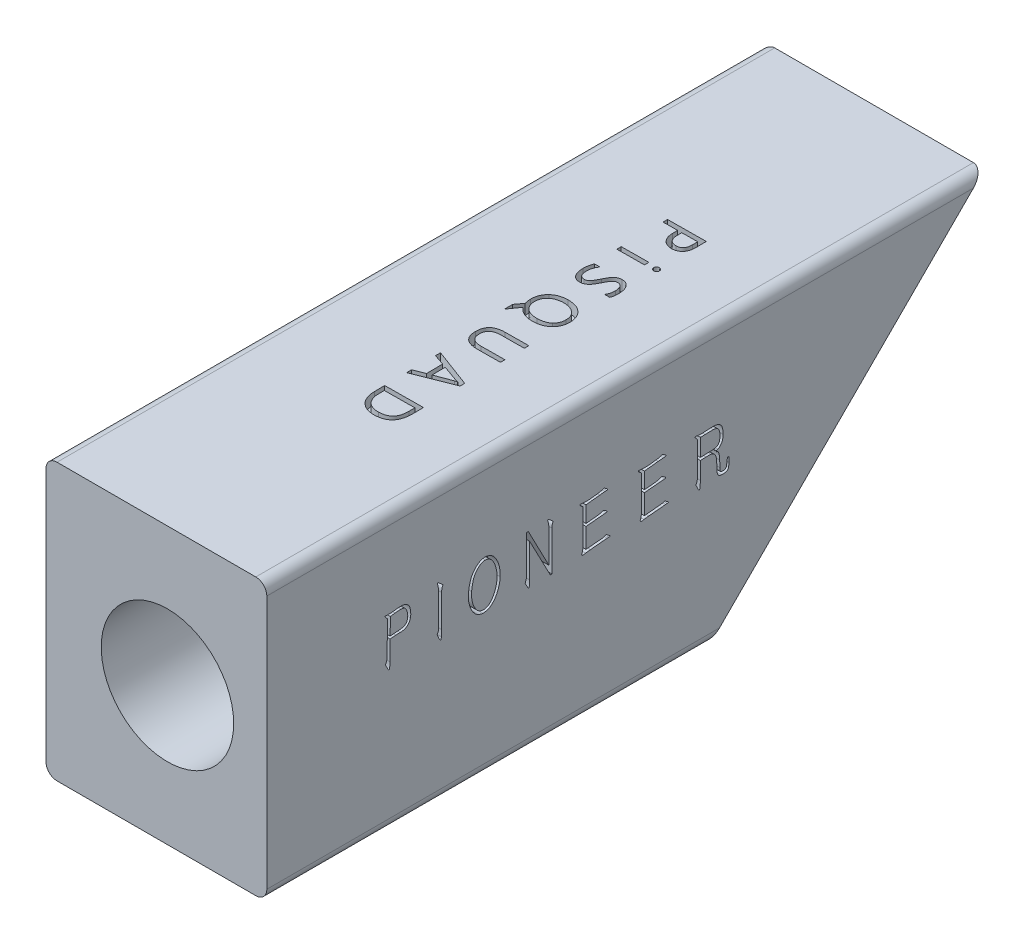
from build123d import *

# Parameters (mm, degrees)
BOSS_EXTRUDE1_DEPTH     = 20
CUT_EXTRUDE1_DEPTH      = 43
CUT_EXTRUDE1_DEPTH_BACK = 67
SKETCH2_R               = 6
FILLET1_R               = 1
SKETCH4_R               = 11
CUT_EXTRUDE2_DEPTH      = 2
CUT_EXTRUDE3_DEPTH      = 1
CUT_EXTRUDE4_DEPTH      = 1


with BuildPart() as part:
    # Sketch1 → Boss-Extrude1 (new body)
    with BuildSketch(Plane(origin=(0, 0, 0), x_dir=(0, 0, -1), z_dir=(1, 0, 0))):
        Polygon((45, 12.5), (-20, 12.5), (-20, -12.5), (20, -12.5), align=None)
    extrude(amount=BOSS_EXTRUDE1_DEPTH)

    # Sketch2 → Cut-Extrude1 (cut, two sides: drawn at the far end of the back side and taken through both)
    with BuildSketch(Plane.XY.offset(-CUT_EXTRUDE1_DEPTH_BACK)):
        with Locations((11, 0)):
            Circle(SKETCH2_R)
    extrude(amount=CUT_EXTRUDE1_DEPTH + CUT_EXTRUDE1_DEPTH_BACK, mode=Mode.SUBTRACT)

    # Fillet1
    fillet1_edges = [part.edges().sort_by_distance(p)[0] for p in [
        (0, 12.5, -12.5),
        (0, -12.5, 0),
        (20, -12.5, 0),
        (20, 12.5, -12.5),
    ]]
    fillet(fillet1_edges, radius=FILLET1_R)

    # Sketch4 → Cut-Extrude2 (cut)
    with BuildSketch(Plane.ZY):
        Circle(SKETCH4_R)
    extrude(amount=-CUT_EXTRUDE2_DEPTH, mode=Mode.SUBTRACT)

    # Sketch5 → Cut-Extrude3 (cut)
    # profile 1 of 8: a face of its own
    with BuildSketch(Plane(origin=(0, 12.5, 0), x_dir=(1, 0, 0), z_dir=(0, 1, 0))):
        with BuildLine():
            Line((10.923109963, 26.290796431), (9.607012101, 26.279283273))
            Line((9.607012101, 26.279283273), (9.604133812, 26.687280806))
            Line((9.604133812, 26.687280806), (13.086864075, 26.717502846))
            Line((13.086864075, 26.717502846), (13.094779371, 25.761191168))
            add(Edge.make_bspline(
                [(13.094779371, 25.761191168), (13.094474458, 25.71583244), (13.093881285, 25.627592282), (13.082162329, 25.499148523), (13.062346751, 25.378533615), (13.033475802, 25.265603452), (12.996458274, 25.160313113), (12.949895034, 25.063015403), (12.895281765, 24.97324397), (12.831641437, 24.892038866), (12.761295356, 24.818410817), (12.681851906, 24.756070948), (12.596804189, 24.701216734), (12.503715053, 24.657485912), (12.40417014, 24.622668103), (12.297153221, 24.598762166), (12.183584935, 24.582257996), (12.105189105, 24.580059045), (12.065071312, 24.578933767)],
                knots=[0, 0, 0, 0, 1.221701374, 2.376678736, 3.470994319, 4.511770909, 5.513366762, 6.473054638, 7.412954823, 8.338548984, 9.248029584, 10.149322212, 11.052905708, 11.969248683, 12.913493508, 13.888572598, 14.919511302, 16, 16, 16, 16], degree=3))
            add(Edge.make_bspline(
                [(12.065071312, 24.578933767), (12.024726222, 24.579575067), (11.945414418, 24.580835757), (11.829219323, 24.596345284), (11.718453132, 24.622020727), (11.613670073, 24.659091377), (11.513932969, 24.705960715), (11.420401823, 24.764697), (11.331931996, 24.833652503), (11.249434204, 24.912473878), (11.174802559, 25.00068962), (11.109579628, 25.097265938), (11.054075883, 25.201169338), (11.008463387, 25.312791764), (10.973486006, 25.432243458), (10.947626032, 25.559063142), (10.931758536, 25.693401745), (10.9288933, 25.785374201), (10.927427398, 25.832428832)],
                knots=[0, 0, 0, 0, 1.016311944, 1.997901951, 2.948142108, 3.877399555, 4.794143846, 5.72015072, 6.654957076, 7.617047025, 8.590842581, 9.561706143, 10.548921141, 11.554840612, 12.595425369, 13.68148555, 14.813809629, 16, 16, 16, 16], degree=3))
            Line((10.927427398, 25.832428832), (10.923109963, 26.290796431))
        make_face()
        with BuildLine():
            Line((12.72060174, 26.306627023), (11.292250588, 26.293674721))
            Line((11.292250588, 26.293674721), (11.296568023, 25.866248734))
            add(Edge.make_bspline(
                [(11.296568023, 25.866248734), (11.29725283, 25.832158778), (11.29858698, 25.765744364), (11.309076975, 25.66938031), (11.324277398, 25.578987084), (11.347038554, 25.495463595), (11.373789682, 25.417703219), (11.408164196, 25.346852887), (11.447439522, 25.28144993), (11.493917783, 25.223233676), (11.544971318, 25.170976342), (11.601555423, 25.126056), (11.663158287, 25.088316431), (11.729821104, 25.05826375), (11.800921807, 25.034406571), (11.876754051, 25.016868184), (11.957871057, 25.007844882), (12.013482028, 25.006863706), (12.042044996, 25.006359753)],
                knots=[0, 0, 0, 0, 1.263550358, 2.461662288, 3.590338682, 4.658096108, 5.66784211, 6.63437192, 7.572333741, 8.490354779, 9.389576543, 10.275642468, 11.161753016, 12.061106685, 12.980676982, 13.938494696, 14.941167359, 16, 16, 16, 16], degree=3))
            add(Edge.make_bspline(
                [(12.042044996, 25.006359753), (12.06989833, 25.007369037), (12.124103965, 25.009333214), (12.202653991, 25.019319641), (12.275810768, 25.035604014), (12.343129516, 25.05905626), (12.405806558, 25.087322294), (12.462020395, 25.124069602), (12.513737097, 25.165728752), (12.559380365, 25.214469373), (12.599163887, 25.269797526), (12.633451177, 25.331272658), (12.663594437, 25.398421975), (12.685719357, 25.47268161), (12.705158593, 25.552484036), (12.716520914, 25.639313595), (12.723965673, 25.73203324), (12.724595317, 25.795953589), (12.724919174, 25.828830971)],
                knots=[0, 0, 0, 0, 1.092760076, 2.126630679, 3.10114116, 4.026408532, 4.918709526, 5.790338198, 6.652831066, 7.518039001, 8.40061612, 9.318970533, 10.275144277, 11.280851964, 12.353378912, 13.49358346, 14.710826645, 16, 16, 16, 16], degree=3))
            Line((12.724919174, 25.828830971), (12.72060174, 26.306627023))
        make_face(mode=Mode.SUBTRACT)
    # profile 2 of 8: a face of its own
    with BuildSketch(Plane(origin=(0, 12.5, 0), x_dir=(1, 0, 0), z_dir=(0, 1, 0))):
        with BuildLine():
            add(Edge.make_bspline(
                [(12.759834072, 22.281493487), (12.760609371, 22.298850627), (12.762118773, 22.332642622), (12.775582932, 22.381395664), (12.798152782, 22.426102747), (12.830069304, 22.465109383), (12.867860731, 22.498979168), (12.91274339, 22.52243246), (12.961888259, 22.538745566), (12.996674329, 22.540405506), (13.01456269, 22.541259112)],
                knots=[0, 0, 0, 0, 1.025550426, 1.996607361, 2.967871765, 3.967656224, 4.963806558, 5.948258015, 6.944913882, 8, 8, 8, 8], degree=3))
            add(Edge.make_bspline(
                [(13.01456269, 22.541259112), (13.032636839, 22.540531691), (13.067671692, 22.539121662), (13.117955788, 22.525203407), (13.162604804, 22.500578456), (13.201846867, 22.468177588), (13.235295894, 22.429990811), (13.25847196, 22.385466485), (13.273708075, 22.337163882), (13.275546077, 22.303199047), (13.276487032, 22.285810921)],
                knots=[0, 0, 0, 0, 1.062516067, 2.059576563, 3.038979646, 4.042519484, 5.044269238, 6.004549144, 6.978439021, 8, 8, 8, 8], degree=3))
            add(Edge.make_bspline(
                [(13.276487032, 22.285810921), (13.276070036, 22.268193255), (13.275250671, 22.233575867), (13.260606541, 22.184123794), (13.238321792, 22.138106852), (13.205454502, 22.098643653), (13.167342729, 22.06416817), (13.121945559, 22.040393099), (13.072249011, 22.024266975), (13.037003149, 22.022590095), (13.018880124, 22.021727862)],
                knots=[0, 0, 0, 0, 1.022706302, 2.009540815, 2.978395056, 3.982499012, 4.98309483, 5.952453026, 6.947174454, 8, 8, 8, 8], degree=3))
            add(Edge.make_bspline(
                [(13.018880124, 22.021727862), (13.001748556, 22.022456058), (12.96810397, 22.023886157), (12.919653223, 22.038295793), (12.874749727, 22.061496587), (12.835665025, 22.094959855), (12.802477706, 22.134677466), (12.778755683, 22.18018458), (12.762416721, 22.229310584), (12.760707342, 22.263848887), (12.759834072, 22.281493487)],
                knots=[0, 0, 0, 0, 1.005736925, 1.97516089, 2.947457836, 3.959514003, 4.982437541, 5.973808908, 6.964878778, 8, 8, 8, 8], degree=3))
        make_face()
    # profile 3 of 8: a face of its own
    with BuildSketch(Plane(origin=(0, 12.5, 0), x_dir=(1, 0, 0), z_dir=(0, 1, 0))):
        Polygon((9.643366144, 22.059865198), (9.639768282, 22.45850829), (12.126610387, 22.480095461), (12.130208249, 22.081452369), align=None)
    # profile 4 of 8: a face of its own
    with BuildSketch(Plane(origin=(0, 12.5, 0), x_dir=(1, 0, 0), z_dir=(0, 1, 0))):
        with BuildLine():
            Line((9.802757307, 19.898366029), (10.28343165, 19.902683463))
            add(Edge.make_bspline(
                [(10.28343165, 19.902683463), (10.259752854, 19.872823779), (10.210203558, 19.810340605), (10.151765192, 19.70159033), (10.098532648, 19.583876825), (10.055207657, 19.45947972), (10.021612242, 19.331822326), (9.996797109, 19.20494271), (9.980705548, 19.082303403), (9.979101035, 19.00254225), (9.978332965, 18.964361094)],
                knots=[0, 0, 0, 0, 0.909527534, 1.903240743, 2.94027437, 3.997658092, 5.047879587, 6.093833657, 7.087530318, 8, 8, 8, 8], degree=3))
            add(Edge.make_bspline(
                [(9.978332965, 18.964361094), (9.978948799, 18.933883337), (9.98013859, 18.875000245), (9.987456882, 18.789712542), (9.998654913, 18.710585966), (10.014613947, 18.637260175), (10.034360608, 18.56972712), (10.058969843, 18.508063788), (10.087524668, 18.452375521), (10.120928713, 18.402900386), (10.158502805, 18.359528549), (10.199796032, 18.321876275), (10.244614844, 18.289478023), (10.294106927, 18.264943884), (10.346268708, 18.243829009), (10.40311653, 18.23095482), (10.463255013, 18.221650791), (10.504780654, 18.221247973), (10.525927538, 18.221042838)],
                knots=[0, 0, 0, 0, 1.394376791, 2.693938997, 3.913771134, 5.048124552, 6.124462512, 7.129099216, 8.081302708, 8.98223275, 9.853535778, 10.700234808, 11.53454018, 12.373810629, 13.221575718, 14.102568969, 15.033735525, 16, 16, 16, 16], degree=3))
            add(Edge.make_bspline(
                [(10.525927538, 18.221042838), (10.548773106, 18.221865899), (10.593129287, 18.223463926), (10.657299404, 18.236045017), (10.716591018, 18.256166447), (10.771531995, 18.283917456), (10.822002661, 18.31952949), (10.871083867, 18.359449447), (10.917220049, 18.406067788), (10.977420744, 18.477458287), (11.047608074, 18.58140394), (11.125623471, 18.721982599), (11.204367177, 18.877469492), (11.258492369, 18.985449171), (11.286515531, 19.041355338)],
                knots=[0, 0, 0, 0, 0.694754918, 1.348912603, 1.98133275, 2.594985317, 3.214469777, 3.857415669, 4.518015618, 5.206763897, 6.696836466, 8.324553812, 10.097048341, 12, 12, 12, 12], degree=3))
            add(Edge.make_bspline(
                [(11.286515531, 19.041355338), (11.316615209, 19.100546623), (11.375142892, 19.215641831), (11.452468456, 19.355119451), (11.516998873, 19.459024329), (11.567228346, 19.531011754), (11.619997764, 19.597665689), (11.675561517, 19.659165492), (11.734309558, 19.715488752), (11.797184153, 19.765344669), (11.863650735, 19.808752909), (11.934153697, 19.845762598), (12.009650059, 19.876912699), (12.091766084, 19.897839917), (12.180039249, 19.911112282), (12.240858068, 19.913144842), (12.272329676, 19.914196621)],
                knots=[0, 0, 0, 0, 1.991748835, 3.872880072, 4.781138777, 5.659323326, 6.504255845, 7.329384323, 8.143588483, 8.942454958, 9.732657316, 10.521089169, 11.32801381, 12.176095253, 13.05619322, 14, 14, 14, 14], degree=3))
            add(Edge.make_bspline(
                [(12.272329676, 19.914196621), (12.310763446, 19.913144469), (12.385680311, 19.911093568), (12.494476036, 19.89361782), (12.59490615, 19.860433434), (12.687661562, 19.815576941), (12.772226725, 19.759717046), (12.850393358, 19.696253101), (12.919298906, 19.622741431), (12.981586245, 19.542176242), (13.034752557, 19.453827642), (13.083376952, 19.360665852), (13.122163331, 19.260476958), (13.154574776, 19.155615469), (13.179266571, 19.04725644), (13.198193503, 18.937047094), (13.210000893, 18.82549628), (13.211873555, 18.750675642), (13.212810761, 18.713230338)],
                knots=[0, 0, 0, 0, 1.080537334, 2.106232892, 3.08527093, 4.044570117, 4.994935645, 5.929370513, 6.869242421, 7.821688023, 8.787627346, 9.764991097, 10.773262619, 11.803737319, 12.849223604, 13.895992789, 14.947012566, 16, 16, 16, 16], degree=3))
            add(Edge.make_bspline(
                [(13.212810761, 18.713230338), (13.21292615, 18.671728183), (13.213148356, 18.591806459), (13.207744769, 18.476134796), (13.199643611, 18.369000519), (13.186726076, 18.270545001), (13.170190124, 18.180696108), (13.15054465, 18.09948946), (13.126400577, 18.026536364), (13.105538465, 17.98244832), (13.095520465, 17.961277213)],
                knots=[0, 0, 0, 0, 1.297668763, 2.498952813, 3.620198206, 4.656646351, 5.602616275, 6.475845398, 7.268099954, 8, 8, 8, 8], degree=3))
            Line((13.095520465, 17.961277213), (12.636433294, 17.957679351))
            add(Edge.make_bspline(
                [(12.636433294, 17.957679351), (12.653525761, 17.984230763), (12.687876323, 18.037590872), (12.729900257, 18.124041889), (12.766149713, 18.215144151), (12.7957618, 18.311834355), (12.817712134, 18.414214287), (12.833385372, 18.521662506), (12.843178135, 18.63437284), (12.843503602, 18.711290887), (12.843670136, 18.750648101)],
                knots=[0, 0, 0, 0, 0.909905766, 1.82862863, 2.766268587, 3.735546208, 4.740876976, 5.782666551, 6.865440926, 8, 8, 8, 8], degree=3))
            add(Edge.make_bspline(
                [(12.843670136, 18.750648101), (12.841728935, 18.795344346), (12.83783411, 18.88502283), (12.818843548, 18.99572955), (12.797045217, 19.082063167), (12.776895212, 19.143877459), (12.749978089, 19.201023848), (12.721199504, 19.255455517), (12.686390225, 19.304757772), (12.647984038, 19.350464781), (12.604188218, 19.390227271), (12.556374381, 19.425485979), (12.503329422, 19.454039785), (12.444561594, 19.474143969), (12.3802469, 19.48575982), (12.33570121, 19.486899718), (12.312625729, 19.487490206)],
                knots=[0, 0, 0, 0, 1.845434707, 3.702677691, 4.62241544, 5.521019363, 6.380592896, 7.226891474, 8.059114754, 8.86670774, 9.686588796, 10.494606529, 11.314068988, 12.162623364, 13.048205344, 14, 14, 14, 14], degree=3))
            add(Edge.make_bspline(
                [(12.312625729, 19.487490206), (12.290996579, 19.486798259), (12.249169927, 19.485460165), (12.188748243, 19.475189357), (12.132992811, 19.458587804), (12.081291414, 19.436074366), (12.033313693, 19.407641609), (11.98812573, 19.373154285), (11.945075395, 19.332815023), (11.888855903, 19.269222471), (11.823063625, 19.174460917), (11.761871464, 19.069090612), (11.713718804, 18.974066097), (11.674244028, 18.895823836), (11.632383723, 18.812531102), (11.604494413, 18.755001017), (11.590175071, 18.725463068)],
                knots=[0, 0, 0, 0, 0.813813059, 1.573759345, 2.299300396, 2.998757306, 3.690892312, 4.393314638, 5.134307473, 5.908072096, 7.584180529, 9.465588082, 10.491221054, 11.593505116, 12.764421722, 14, 14, 14, 14], degree=3))
            add(Edge.make_bspline(
                [(11.590175071, 18.725463068), (11.559842003, 18.664217803), (11.499991728, 18.543374567), (11.417136843, 18.398486629), (11.349086899, 18.287897202), (11.294026703, 18.212036671), (11.237316056, 18.140118425), (11.176875996, 18.07408067), (11.113669349, 18.013431628), (11.047200269, 17.959018579), (10.977092115, 17.911415889), (10.903552412, 17.869940132), (10.825385288, 17.836244878), (10.741420781, 17.81275177), (10.652200483, 17.796991553), (10.590519193, 17.795233828), (10.559027867, 17.794336423)],
                knots=[0, 0, 0, 0, 1.949593011, 3.846748396, 4.760047279, 5.65265092, 6.519433597, 7.371997273, 8.204550148, 9.016858748, 9.81977283, 10.619413753, 11.422765192, 12.241534347, 13.102216949, 14, 14, 14, 14], degree=3))
            add(Edge.make_bspline(
                [(10.559027867, 17.794336423), (10.517696167, 17.794995261), (10.437719261, 17.796270113), (10.322740644, 17.814775278), (10.217074977, 17.844316453), (10.121916847, 17.888468162), (10.035732354, 17.94264729), (9.958567005, 18.006675741), (9.888469965, 18.078359202), (9.827552878, 18.159506838), (9.774167514, 18.247977164), (9.729831617, 18.344158563), (9.691333443, 18.445874701), (9.662333003, 18.554264287), (9.640497534, 18.667151417), (9.623840037, 18.783363577), (9.613691023, 18.902784262), (9.611660431, 18.983291056), (9.610631485, 19.024085601)],
                knots=[0, 0, 0, 0, 1.12803779, 2.182754968, 3.171987688, 4.116178941, 5.037932538, 5.945768266, 6.849431976, 7.770789505, 8.711426701, 9.667077362, 10.660295621, 11.679292766, 12.727967073, 13.800188193, 14.885307481, 16, 16, 16, 16], degree=3))
            add(Edge.make_bspline(
                [(9.610631485, 19.024085601), (9.611307771, 19.055040392), (9.612798689, 19.123282301), (9.621820483, 19.2325372), (9.636241039, 19.352440247), (9.658024825, 19.476034227), (9.684391701, 19.597865234), (9.712825047, 19.695406878), (9.737744663, 19.768422249), (9.757478097, 19.817181625), (9.779257587, 19.860073188), (9.795160397, 19.885986848), (9.802757307, 19.898366029)],
                knots=[0, 0, 0, 0, 1.027653548, 2.265531062, 3.63734406, 5.035411277, 6.430209537, 7.773321957, 8.40537434, 8.990927966, 9.517957508, 10, 10, 10, 10], degree=3))
        make_face()
    # profile 5 of 8: a face of its own
    with BuildSketch(Plane(origin=(0, 12.5, 0), x_dir=(1, 0, 0), z_dir=(0, 1, 0))):
        with BuildLine():
            add(Edge.make_bspline(
                [(9.651178492, 14.231161712), (9.652205713, 14.291193888), (9.654217949, 14.408791641), (9.676365635, 14.58083738), (9.712714399, 14.744112364), (9.764674913, 14.898667119), (9.832563783, 15.043968778), (9.916157793, 15.180036258), (10.014068919, 15.307996499), (10.090411534, 15.384253692), (10.128974544, 15.422773554)],
                knots=[0, 0, 0, 0, 1.088663926, 2.132596879, 3.140843327, 4.119310026, 5.08495698, 6.044031082, 7.011979729, 8, 8, 8, 8], degree=3))
            add(Edge.make_bspline(
                [(10.128974544, 15.422773554), (10.170265867, 15.458653008), (10.252763761, 15.530338274), (10.388893265, 15.622481334), (10.534274919, 15.700236164), (10.688510503, 15.765084254), (10.852540152, 15.813947615), (11.025417723, 15.851123282), (11.207763342, 15.873402383), (11.332518973, 15.877097838), (11.396141485, 15.878982435)],
                knots=[0, 0, 0, 0, 0.951506505, 1.901060033, 2.853701638, 3.817485097, 4.808025587, 5.828315939, 6.892490914, 8, 8, 8, 8], degree=3))
            add(Edge.make_bspline(
                [(11.396141485, 15.878982435), (11.46455688, 15.878464342), (11.59835351, 15.877451133), (11.793669429, 15.856426647), (11.978668147, 15.823284715), (12.152941354, 15.775105388), (12.316255687, 15.712258827), (12.469261588, 15.635896851), (12.61141322, 15.544308923), (12.697353319, 15.472388378), (12.740302669, 15.436445429)],
                knots=[0, 0, 0, 0, 1.132913998, 2.21558431, 3.249915805, 4.243956588, 5.206314499, 6.14467739, 7.072785566, 8, 8, 8, 8], degree=3))
            add(Edge.make_bspline(
                [(12.740302669, 15.436445429), (12.780586256, 15.398001215), (12.860662925, 15.321580897), (12.963532509, 15.191596306), (13.050933981, 15.051919389), (13.123881877, 14.902401386), (13.179661365, 14.742136438), (13.219639015, 14.571855846), (13.2456122, 14.391690486), (13.249306038, 14.267951243), (13.251199051, 14.204537534)],
                knots=[0, 0, 0, 0, 0.971198436, 1.930571267, 2.884445163, 3.84332438, 4.828647213, 5.840251103, 6.893174999, 8, 8, 8, 8], degree=3))
            add(Edge.make_bspline(
                [(13.251199051, 14.204537534), (13.250478367, 14.145940355), (13.24906711, 14.031194115), (13.226694162, 13.863461303), (13.190339331, 13.704248058), (13.138151472, 13.553489535), (13.071080295, 13.410994377), (12.988413066, 13.276996037), (12.890359178, 13.151425716), (12.814102952, 13.076632236), (12.775561715, 13.038830297)],
                knots=[0, 0, 0, 0, 1.082565615, 2.119902967, 3.121332615, 4.097375783, 5.063395109, 6.026999319, 7.002810778, 8, 8, 8, 8], degree=3))
            add(Edge.make_bspline(
                [(12.775561715, 13.038830297), (12.734506216, 13.003195705), (12.652476528, 12.931997095), (12.516936118, 12.840370383), (12.371672562, 12.763478324), (12.217296255, 12.699609579), (12.053553174, 12.650255547), (11.880447693, 12.61434884), (11.697990074, 12.591693829), (11.572982674, 12.588070497), (11.509114347, 12.586219277)],
                knots=[0, 0, 0, 0, 0.947040138, 1.892204683, 2.844298732, 3.807918914, 4.799940437, 5.820891907, 6.886658012, 8, 8, 8, 8], degree=3))
            add(Edge.make_bspline(
                [(11.509114347, 12.586219277), (11.439749462, 12.586815248), (11.304559586, 12.587976774), (11.107214195, 12.607765021), (10.921195081, 12.641402223), (10.745740483, 12.68845857), (10.581781112, 12.751483369), (10.428702609, 12.827928822), (10.28559101, 12.917652536), (10.200373358, 12.989798838), (10.157757439, 13.025877994)],
                knots=[0, 0, 0, 0, 1.143962991, 2.22954618, 3.267303387, 4.259919065, 5.221914841, 6.15986042, 7.079777032, 8, 8, 8, 8], degree=3))
            add(Edge.make_bspline(
                [(10.157757439, 13.025877994), (10.119458647, 13.061317097), (10.044157212, 13.130995935), (9.981855052, 13.212495115), (9.951240169, 13.25254329)],
                knots=[0, 0, 0, 0, 1.017212798, 2, 2, 2, 2], degree=3))
            Line((9.951240169, 13.25254329), (9.258291979, 12.267448718))
            Line((9.258291979, 12.267448718), (9.251815827, 13.007888685))
            Line((9.251815827, 13.007888685), (9.736088031, 13.668456119))
            add(Edge.make_bspline(
                [(9.736088031, 13.668456119), (9.723296924, 13.711917077), (9.69726725, 13.800359349), (9.672750622, 13.938579551), (9.655186299, 14.082729008), (9.652533578, 14.180974906), (9.651178492, 14.231161712)],
                knots=[0, 0, 0, 0, 0.951317699, 1.935914497, 2.945606265, 4, 4, 4, 4], degree=3))
        make_face()
        with BuildLine():
            add(Edge.make_bspline(
                [(12.882058426, 14.229722567), (12.880669301, 14.274425301), (12.877943759, 14.362134608), (12.856725149, 14.490001712), (12.825808296, 14.611940553), (12.780383656, 14.726682667), (12.724591806, 14.835730026), (12.654161198, 14.936812614), (12.573273784, 15.032753786), (12.510279709, 15.089126612), (12.478378327, 15.117674869)],
                knots=[0, 0, 0, 0, 1.063891147, 2.08741491, 3.079326943, 4.054070689, 5.019719015, 5.98927823, 6.981732772, 8, 8, 8, 8], degree=3))
            add(Edge.make_bspline(
                [(12.478378327, 15.117674869), (12.444413946, 15.145101026), (12.376647912, 15.199821938), (12.264196903, 15.267839084), (12.145379202, 15.326881416), (12.017685378, 15.373119713), (11.88305837, 15.410308265), (11.74033953, 15.434670198), (11.59055656, 15.450651789), (11.488050812, 15.451250689), (11.435717965, 15.451556448)],
                knots=[0, 0, 0, 0, 0.93525518, 1.866029459, 2.811540909, 3.776648883, 4.77370362, 5.802934709, 6.878319687, 8, 8, 8, 8], degree=3))
            add(Edge.make_bspline(
                [(11.435717965, 15.451556448), (11.383617641, 15.450220346), (11.281527975, 15.447602277), (11.132412252, 15.429835291), (10.990903187, 15.402760496), (10.857086597, 15.365555089), (10.731363828, 15.317192962), (10.613510874, 15.25840401), (10.502267482, 15.190602875), (10.435188099, 15.136203803), (10.401692472, 15.109040001)],
                knots=[0, 0, 0, 0, 1.124169595, 2.202790443, 3.236188269, 4.230866631, 5.195961516, 6.138088872, 7.070267524, 8, 8, 8, 8], degree=3))
            add(Edge.make_bspline(
                [(10.401692472, 15.109040001), (10.370801958, 15.080427331), (10.310031148, 15.024137714), (10.231327624, 14.929359811), (10.163822405, 14.829408939), (10.109476708, 14.722511694), (10.067492485, 14.609508294), (10.038160404, 14.490011208), (10.020452857, 14.36434103), (10.018933734, 14.278472373), (10.0181604, 14.234759573)],
                knots=[0, 0, 0, 0, 1.022999759, 2.012544204, 2.988047181, 3.950629948, 4.921413144, 5.913104128, 6.937632589, 8, 8, 8, 8], degree=3))
            add(Edge.make_bspline(
                [(10.0181604, 14.234759573), (10.019671925, 14.188158679), (10.02262168, 14.097216627), (10.041850634, 13.96471863), (10.07150649, 13.839889796), (10.113973433, 13.722844516), (10.166604627, 13.612814631), (10.2333962, 13.511844048), (10.30930954, 13.416720799), (10.369258214, 13.361661337), (10.399533755, 13.333854968)],
                knots=[0, 0, 0, 0, 1.107541294, 2.161376514, 3.176370973, 4.1520447, 5.115902815, 6.067901108, 7.024242986, 8, 8, 8, 8], degree=3))
            add(Edge.make_bspline(
                [(10.399533755, 13.333854968), (10.43181209, 13.307615535), (10.497039523, 13.254591398), (10.606752591, 13.189324479), (10.724337396, 13.132228871), (10.85222287, 13.088418468), (10.988253216, 13.052745213), (11.133995625, 13.028878409), (11.288608753, 13.014023212), (11.394906154, 13.013297607), (11.44938984, 13.012925692)],
                knots=[0, 0, 0, 0, 0.888630798, 1.795727863, 2.722741428, 3.680021302, 4.681662972, 5.727458161, 6.835188288, 8, 8, 8, 8], degree=3))
            add(Edge.make_bspline(
                [(11.44938984, 13.012925692), (11.505565359, 13.014270865), (11.614565493, 13.016880971), (11.77292559, 13.034110292), (11.92161616, 13.059057441), (12.059921996, 13.095979693), (12.188501803, 13.141942457), (12.306895515, 13.198209144), (12.416127653, 13.26401741), (12.480873475, 13.316991304), (12.512917801, 13.343209409)],
                knots=[0, 0, 0, 0, 1.185406818, 2.300103399, 3.358699395, 4.364325713, 5.31709008, 6.236387207, 7.127143925, 8, 8, 8, 8], degree=3))
            add(Edge.make_bspline(
                [(12.512917801, 13.343209409), (12.542925796, 13.370549152), (12.602324202, 13.424665969), (12.677939892, 13.518178854), (12.742512766, 13.618394693), (12.794435332, 13.726595378), (12.834854501, 13.841717107), (12.863673177, 13.96419465), (12.880524232, 14.094443453), (12.88153829, 14.183859056), (12.882058426, 14.229722567)],
                knots=[0, 0, 0, 0, 0.979966963, 1.939765557, 2.896635711, 3.856014001, 4.83330214, 5.840132684, 6.89214975, 8, 8, 8, 8], degree=3))
        make_face(mode=Mode.SUBTRACT)
    # profile 6 of 8: a face of its own
    with BuildSketch(Plane(origin=(0, 12.5, 0), x_dir=(1, 0, 0), z_dir=(0, 1, 0))):
        with BuildLine():
            add(Edge.make_bspline(
                [(11.17263268, 7.896234054), (11.113354908, 7.896589698), (10.998443221, 7.897279125), (10.83160753, 7.912136743), (10.676148947, 7.936005648), (10.531806178, 7.970411852), (10.398815982, 8.015467411), (10.277265052, 8.071755099), (10.16701653, 8.13810545), (10.068075228, 8.215039022), (9.980379094, 8.302606996), (9.904309266, 8.400976642), (9.840917786, 8.510536438), (9.787247783, 8.629377535), (9.746526315, 8.759209251), (9.717446005, 8.899024198), (9.698282652, 9.049192174), (9.695398742, 9.153026355), (9.693911463, 9.206575337)],
                knots=[0, 0, 0, 0, 1.255745004, 2.434298259, 3.545733077, 4.586248364, 5.574812864, 6.516297513, 7.419404238, 8.295855165, 9.16564817, 10.038983591, 10.922948769, 11.84211923, 12.796982904, 13.799883164, 14.865363819, 16, 16, 16, 16], degree=3))
            add(Edge.make_bspline(
                [(9.693911463, 9.206575337), (9.694553515, 9.257699569), (9.695801505, 9.357072532), (9.710792366, 9.501374235), (9.737472396, 9.635974908), (9.774423086, 9.761168989), (9.823569065, 9.876299192), (9.883746617, 9.981547066), (9.954470639, 10.0774758), (10.037237365, 10.162804575), (10.131094977, 10.238289028), (10.235968645, 10.303824212), (10.352057206, 10.359522832), (10.479386444, 10.404331191), (10.617480567, 10.440560431), (10.766811286, 10.465648539), (10.926874609, 10.482709452), (11.037306344, 10.485339576), (11.094199292, 10.48669458)],
                knots=[0, 0, 0, 0, 1.128084499, 2.192719487, 3.196710497, 4.153063646, 5.0685707, 5.953076793, 6.823432431, 7.69204742, 8.569283193, 9.475575022, 10.415611896, 11.405263457, 12.450504079, 13.562826144, 14.744400728, 16, 16, 16, 16], degree=3))
            Line((11.094199292, 10.48669458), (13.224133503, 10.505403462))
            Line((13.224133503, 10.505403462), (13.227731364, 10.097405929))
            Line((13.227731364, 10.097405929), (11.124421332, 10.07941662))
            add(Edge.make_bspline(
                [(11.124421332, 10.07941662), (11.081213238, 10.078608887), (10.997255448, 10.077039378), (10.875910259, 10.064376462), (10.762901143, 10.045874625), (10.658100499, 10.020933292), (10.561534237, 9.98895481), (10.473529765, 9.949069519), (10.394139719, 9.902288499), (10.322480086, 9.848661531), (10.260089642, 9.787497857), (10.20569089, 9.719484267), (10.160707453, 9.644188997), (10.122583979, 9.562480709), (10.094987933, 9.473003594), (10.07513699, 9.37711325), (10.062245568, 9.274325014), (10.061828081, 9.203497451), (10.061612943, 9.166998857)],
                knots=[0, 0, 0, 0, 1.293016469, 2.512464564, 3.647905691, 4.718821718, 5.733665093, 6.687909281, 7.605221135, 8.48686072, 9.36009991, 10.213366299, 11.086339829, 11.979393733, 12.905791565, 13.881587772, 14.908347721, 16, 16, 16, 16], degree=3))
            add(Edge.make_bspline(
                [(10.061612943, 9.166998857), (10.062678943, 9.131698627), (10.064745828, 9.063254358), (10.077826172, 8.964239546), (10.098635569, 8.872176217), (10.127176647, 8.786488662), (10.164915024, 8.708046238), (10.209462045, 8.635678246), (10.263545075, 8.571366255), (10.324881389, 8.513301438), (10.394821916, 8.462817047), (10.472163869, 8.418710621), (10.557852393, 8.381862643), (10.651594527, 8.352922061), (10.753098677, 8.329791942), (10.862520788, 8.313473807), (10.980096235, 8.304024276), (11.061081122, 8.303686276), (11.10283416, 8.303512015)],
                knots=[0, 0, 0, 0, 1.094183675, 2.121533006, 3.090082854, 4.016449421, 4.914362449, 5.782858456, 6.643425747, 7.511285027, 8.3946433, 9.310386804, 10.266153273, 11.279634242, 12.347379143, 13.490364018, 14.706117482, 16, 16, 16, 16], degree=3))
            Line((11.10283416, 8.303512015), (13.242842384, 8.322220896))
            Line((13.242842384, 8.322220896), (13.246440246, 7.914223363))
            Line((13.246440246, 7.914223363), (11.17263268, 7.896234054))
        make_face()
    # profile 7 of 8: a face of its own
    with BuildSketch(Plane(origin=(0, 12.5, 0), x_dir=(1, 0, 0), z_dir=(0, 1, 0))):
        Polygon((9.806584918, 2.854366329), (9.802987056, 3.306257777), (10.775848898, 3.68403327), (10.762896595, 5.16059577), (9.783558602, 5.499514356), (9.77996074, 5.95356452), (13.274204161, 4.647540671), (13.277802023, 4.225151691), align=None)
        with BuildLine():
            Line((11.141391661, 3.82075202), (12.620832451, 4.37985975))
            add(Edge.make_bspline(
                [(12.620832451, 4.37985975), (12.634688153, 4.384605307), (12.665668499, 4.395216028), (12.718759635, 4.408208389), (12.782185608, 4.422867956), (12.828499749, 4.430948063), (12.853254326, 4.435266823)],
                knots=[0, 0, 0, 0, 0.734400858, 1.642067073, 2.739701698, 4, 4, 4, 4], degree=3))
            Line((12.853254326, 4.435266823), (12.853254326, 4.445340836))
            add(Edge.make_bspline(
                [(12.853254326, 4.445340836), (12.829700242, 4.448921485), (12.785304301, 4.455670476), (12.723052306, 4.469131008), (12.668237705, 4.481991825), (12.634914998, 4.493314907), (12.619393306, 4.498589191)],
                knots=[0, 0, 0, 0, 1.189875312, 2.242737785, 3.181468564, 4, 4, 4, 4], degree=3))
            Line((12.619393306, 4.498589191), (11.130598076, 5.027474882))
            Line((11.130598076, 5.027474882), (11.141391661, 3.82075202))
        make_face(mode=Mode.SUBTRACT)
    # profile 8 of 8: a face of its own
    with BuildSketch(Plane(origin=(0, 12.5, 0), x_dir=(1, 0, 0), z_dir=(0, 1, 0))):
        with BuildLine():
            Line((9.823430778, 0.852685225), (13.306161041, 0.882907264))
            Line((13.306161041, 0.882907264), (13.314076337, -0.07844142))
            add(Edge.make_bspline(
                [(13.314076337, -0.07844142), (13.313400969, -0.152838232), (13.312091623, -0.297072389), (13.293723135, -0.506231077), (13.263841208, -0.701395481), (13.218179177, -0.882124816), (13.160219308, -1.049032592), (13.089252101, -1.201994663), (13.003563688, -1.340078116), (12.904350096, -1.464078611), (12.791759622, -1.574201935), (12.665030289, -1.668855583), (12.526108972, -1.750360781), (12.372727401, -1.815430066), (12.206677896, -1.867371794), (12.027049421, -1.904044589), (11.834341796, -1.928579027), (11.701114918, -1.931825441), (11.632435712, -1.933498986)],
                knots=[0, 0, 0, 0, 1.24331188, 2.410426437, 3.506678418, 4.540432577, 5.521956406, 6.45649141, 7.353294106, 8.231858403, 9.105191738, 9.978497459, 10.869761397, 11.791128886, 12.757482234, 13.773502262, 14.852227864, 16, 16, 16, 16], degree=3))
            add(Edge.make_bspline(
                [(11.632435712, -1.933498986), (11.566885241, -1.932534191), (11.438497709, -1.930644539), (11.250661147, -1.907634343), (11.07225626, -1.870393513), (10.904315736, -1.814774749), (10.745158361, -1.745326777), (10.596855725, -1.657399116), (10.457394195, -1.554837711), (10.329736364, -1.435857819), (10.214087293, -1.303850249), (10.112615613, -1.160055449), (10.02748084, -1.004573752), (9.956682341, -0.838876669), (9.902211276, -0.661705345), (9.861875687, -0.474233697), (9.837239718, -0.275527059), (9.833340851, -0.13943522), (9.831346074, -0.069806552)],
                knots=[0, 0, 0, 0, 1.075707618, 2.106887177, 3.101759431, 4.063192053, 5.006466672, 5.947329463, 6.887788306, 7.843631273, 8.806490468, 9.764699467, 10.727099488, 11.711676359, 12.718126386, 13.765534593, 14.856780446, 16, 16, 16, 16], degree=3))
            Line((9.831346074, -0.069806552), (9.823430778, 0.852685225))
        make_face()
        with BuildLine():
            Line((12.939898705, 0.472031442), (10.195449692, 0.447565981))
            Line((10.195449692, 0.447565981), (10.200486699, -0.071965269))
            add(Edge.make_bspline(
                [(10.200486699, -0.071965269), (10.201977487, -0.127433717), (10.204883812, -0.235570672), (10.224289043, -0.392836381), (10.252785919, -0.540992799), (10.295109029, -0.679061569), (10.347377971, -0.808082997), (10.411685027, -0.927185828), (10.486935795, -1.037160648), (10.574270878, -1.13627227), (10.67146314, -1.225246325), (10.779065977, -1.302119765), (10.89597704, -1.366859329), (11.02234547, -1.419895377), (11.158346981, -1.459746222), (11.3035236, -1.488470394), (11.458137555, -1.505259135), (11.564274158, -1.50627238), (11.618763837, -1.506792571)],
                knots=[0, 0, 0, 0, 1.160330371, 2.262089454, 3.311229952, 4.312958466, 5.278431758, 6.219239913, 7.139355944, 8.060402105, 8.976911841, 9.890476673, 10.820488686, 11.767420299, 12.751840806, 13.780313904, 14.860430986, 16, 16, 16, 16], degree=3))
            add(Edge.make_bspline(
                [(11.618763837, -1.506792571), (11.672785584, -1.505231267), (11.777771769, -1.502197019), (11.929851024, -1.483953692), (12.07164776, -1.45578495), (12.202565851, -1.415430086), (12.322946922, -1.364128489), (12.43331879, -1.302357315), (12.53253021, -1.228137682), (12.621709607, -1.14359935), (12.700136739, -1.047687446), (12.767189147, -0.940422904), (12.823221488, -0.822151147), (12.869577531, -0.693297043), (12.904120687, -0.553336052), (12.929427927, -0.402559376), (12.943761446, -0.240868947), (12.94453697, -0.129319368), (12.944935712, -0.071965269)],
                knots=[0, 0, 0, 0, 1.157169228, 2.248849562, 3.276635533, 4.250088393, 5.177718135, 6.075014209, 6.95257335, 7.824776733, 8.70105649, 9.599131844, 10.527558054, 11.49942322, 12.527478841, 13.611186569, 14.771772642, 16, 16, 16, 16], degree=3))
            Line((12.944935712, -0.071965269), (12.939898705, 0.472031442))
        make_face(mode=Mode.SUBTRACT)
    extrude(amount=-CUT_EXTRUDE3_DEPTH, mode=Mode.SUBTRACT)

    # Sketch6 → Cut-Extrude4 (cut)
    # profile 1 of 7: a face of its own
    with BuildSketch(Plane(origin=(20, 0, 0), x_dir=(0, 0, -1), z_dir=(1, 0, 0))):
        with BuildLine():
            add(Edge.make_bspline(
                [(-8.752746309, 4.548107663), (-8.676529633, 4.556687568), (-8.530898493, 4.573081637), (-8.318908413, 4.601582542), (-8.114225853, 4.625487805), (-7.978209812, 4.631671626), (-7.909519071, 4.634794575)],
                knots=[0, 0, 0, 0, 1.085326249, 2.073788935, 3.02722601, 4, 4, 4, 4], degree=3))
            add(Edge.make_bspline(
                [(-7.909519071, 4.634794575), (-7.870102651, 4.635371889), (-7.795464794, 4.636465073), (-7.689859337, 4.629211283), (-7.596300597, 4.61753851), (-7.513314301, 4.59644454), (-7.437325586, 4.566610005), (-7.3636104, 4.52947631), (-7.292836861, 4.479926243), (-7.222357821, 4.42285922), (-7.158275789, 4.352499977), (-7.102043377, 4.269804891), (-7.058175212, 4.172925933), (-7.025329576, 4.065886178), (-6.999806835, 3.955010447), (-6.979711226, 3.84524828), (-6.96673238, 3.738666392), (-6.96106261, 3.636008485), (-6.960740969, 3.53863023), (-6.966600893, 3.447805763), (-6.977729167, 3.363635179), (-6.990954553, 3.310754175), (-6.997336334, 3.285236963)],
                knots=[0, 0, 0, 0, 1.217979337, 2.306332456, 3.269497102, 4.128642705, 4.944804995, 5.789134025, 6.673101869, 7.610079967, 8.587103045, 9.603353762, 10.688673668, 11.860308523, 13.059277742, 14.204050539, 15.308144684, 16.375615156, 17.380448108, 18.316215995, 19.187506443, 20, 20, 20, 20], degree=3))
            add(Edge.make_bspline(
                [(-6.997336334, 3.285236963), (-7.006125331, 3.255230328), (-7.023331388, 3.196486894), (-7.055581432, 3.111971622), (-7.095537886, 3.034382989), (-7.139075562, 2.962184953), (-7.189326404, 2.898065403), (-7.241901081, 2.839191959), (-7.300697429, 2.788999522), (-7.383336493, 2.731114575), (-7.496408858, 2.675416452), (-7.639888889, 2.632622807), (-7.785449346, 2.612121834), (-7.881888077, 2.608362795), (-7.929220642, 2.606517842)],
                knots=[0, 0, 0, 0, 0.895463538, 1.753032419, 2.585849702, 3.392389525, 4.16366611, 4.915898757, 5.649376957, 6.372103415, 7.802175461, 9.236324082, 10.643575361, 12, 12, 12, 12], degree=3))
            Line((-7.929220642, 2.606517842), (-8.316356511, 2.593711821))
            Line((-8.316356511, 2.593711821), (-8.832537671, 2.54642805))
            Line((-8.832537671, 2.54642805), (-8.842388457, 0.764420954))
            add(Edge.make_bspline(
                [(-8.842388457, 0.764420954), (-8.843943559, 0.725013707), (-8.846743349, 0.6540653), (-8.851602068, 0.559489389), (-8.856192732, 0.488188786), (-8.862764897, 0.4220737), (-8.874276925, 0.349345422), (-8.887203861, 0.279234347), (-8.90091643, 0.225365152), (-8.910342953, 0.197179617), (-8.924088139, 0.176903721), (-8.936046297, 0.178597379), (-8.940896312, 0.179284296)],
                knots=[0, 0, 0, 0, 1.936165496, 3.485852713, 4.649340273, 5.443357571, 6.747443505, 8.258670106, 8.958576954, 9.443540233, 9.774309852, 10, 10, 10, 10], degree=3))
            add(Edge.make_bspline(
                [(-8.940896312, 0.179284296), (-8.942859368, 0.180281533), (-8.951365944, 0.184602895), (-8.970457645, 0.192397718), (-8.994228842, 0.216600609), (-9.004798625, 0.239871235), (-9.010836889, 0.253165187)],
                knots=[0, 0, 0, 0, 0.251703416, 1.090714801, 2.337994894, 4, 4, 4, 4], degree=3))
            Line((-9.010836889, 0.253165187), (-9.060090816, 0.338867021))
            Line((-9.060090816, 0.338867021), (-9.179285321, 0.578241109))
            add(Edge.make_bspline(
                [(-9.179285321, 0.578241109), (-9.190930742, 0.60111905), (-9.211098115, 0.640738741), (-9.235246065, 0.692889511), (-9.249650176, 0.726896465), (-9.257097529, 0.755357637), (-9.238700154, 0.782231976), (-9.216655693, 0.817945593), (-9.187219327, 0.86569999), (-9.163560373, 0.925239554), (-9.141307105, 0.988582364), (-9.123798803, 1.055677953), (-9.110824638, 1.129046689), (-9.109475465, 1.199493779), (-9.108406876, 1.268783168), (-9.106263634, 1.338074394), (-9.1033626, 1.422133834), (-9.100846708, 1.483201113), (-9.099493958, 1.516035888)],
                knots=[0, 0, 0, 0, 1.254230058, 2.172057588, 2.791083131, 3.083529528, 3.542443293, 4.262720784, 5.189043674, 6.25172339, 7.386968099, 8.463693443, 9.633479031, 11.013201902, 11.894775591, 13.01705085, 14.396122052, 16, 16, 16, 16], degree=3))
            Line((-9.099493958, 1.516035888), (-9.079792387, 4.255539334))
            add(Edge.make_bspline(
                [(-9.079792387, 4.255539334), (-9.101533673, 4.284280864), (-9.141937739, 4.337694202), (-9.197465925, 4.395274679), (-9.23491947, 4.434456989), (-9.25510965, 4.458926416), (-9.270402615, 4.478715177), (-9.280688837, 4.500714701), (-9.285827818, 4.523565634), (-9.287765616, 4.540543044), (-9.28862904, 4.548107663)],
                knots=[0, 0, 0, 0, 2.362435807, 4.390357145, 5.244160012, 5.917342317, 6.473432076, 6.878283, 7.500196929, 8, 8, 8, 8], degree=3))
            add(Edge.make_bspline(
                [(-9.28862904, 4.548107663), (-9.287013941, 4.552073523), (-9.282741522, 4.562564405), (-9.259672514, 4.568587211), (-9.228820817, 4.569059304), (-9.203680602, 4.568267386), (-9.189136106, 4.567809234)],
                knots=[0, 0, 0, 0, 0.458891966, 1.213906121, 2.388146974, 4, 4, 4, 4], degree=3))
            Line((-9.189136106, 4.567809234), (-9.089643173, 4.555003213))
            Line((-9.089643173, 4.555003213), (-8.752746309, 4.548107663))
        make_face()
        with BuildLine():
            Line((-8.832537671, 2.779891667), (-8.167609651, 2.826190359))
            add(Edge.make_bspline(
                [(-8.167609651, 2.826190359), (-8.108146113, 2.83031808), (-7.982296611, 2.839054051), (-7.82317638, 2.858135274), (-7.694195467, 2.884453901), (-7.603790264, 2.91002411), (-7.524170794, 2.945374488), (-7.453012687, 2.985959125), (-7.392735403, 3.037439264), (-7.342181576, 3.098137402), (-7.304910878, 3.170796099), (-7.269209697, 3.280377352), (-7.240620479, 3.427964699), (-7.236714233, 3.549099199), (-7.234740264, 3.610312884)],
                knots=[0, 0, 0, 0, 1.50603457, 3.187393613, 4.043194499, 4.83064543, 5.555049745, 6.239394857, 6.892663738, 7.54698526, 8.222371728, 8.941196834, 10.454275112, 12, 12, 12, 12], degree=3))
            add(Edge.make_bspline(
                [(-7.234740264, 3.610312884), (-7.238457364, 3.6491301), (-7.245736816, 3.725148512), (-7.265645347, 3.83502945), (-7.291373237, 3.938340957), (-7.322179863, 4.034138438), (-7.358552659, 4.120053368), (-7.401052841, 4.193972143), (-7.450401296, 4.25354349), (-7.506458029, 4.301368614), (-7.57262781, 4.335782836), (-7.64735751, 4.364798941), (-7.734832208, 4.383659616), (-7.796824388, 4.391342616), (-7.829727708, 4.395420488)],
                knots=[0, 0, 0, 0, 1.274559765, 2.496057682, 3.647007231, 4.753845717, 5.782972715, 6.692593144, 7.531132395, 8.300940148, 9.084108462, 9.957459912, 10.915889896, 12, 12, 12, 12], degree=3))
            add(Edge.make_bspline(
                [(-7.829727708, 4.395420488), (-7.873728065, 4.396973407), (-7.96371673, 4.400149406), (-8.102119357, 4.394075032), (-8.246845048, 4.382973276), (-8.34498507, 4.369047756), (-8.395162795, 4.361927817)],
                knots=[0, 0, 0, 0, 0.930928584, 1.903916816, 2.92829975, 4, 4, 4, 4], degree=3))
            Line((-8.395162795, 4.361927817), (-8.802000236, 4.301838026))
            Line((-8.802000236, 4.301838026), (-8.832537671, 2.779891667))
        make_face(mode=Mode.SUBTRACT)
    # profile 2 of 7: a face of its own
    with BuildSketch(Plane(origin=(20, 0, 0), x_dir=(0, 0, -1), z_dir=(1, 0, 0))):
        with BuildLine():
            Line((-4.560252002, 4.741183059), (-4.48046064, 4.80127285))
            Line((-4.48046064, 4.80127285), (-4.044070842, 4.408226509))
            add(Edge.make_bspline(
                [(-4.044070842, 4.408226509), (-4.053288513, 4.385758484), (-4.070370454, 4.344121339), (-4.099994006, 4.28523229), (-4.12597524, 4.222779463), (-4.142367617, 4.161267182), (-4.154091117, 4.098280608), (-4.158933569, 4.033635527), (-4.16319642, 3.953836167), (-4.163241043, 3.895338899), (-4.163265347, 3.863478071)],
                knots=[0, 0, 0, 0, 1.030819391, 1.910287074, 2.7984446, 3.897900794, 4.606305599, 5.51651908, 6.647359745, 8, 8, 8, 8], degree=3))
            Line((-4.163265347, 3.863478071), (-4.163265347, 0.9506008))
            Line((-4.163265347, 0.9506008), (-4.192817703, 0.398956813))
            add(Edge.make_bspline(
                [(-4.192817703, 0.398956813), (-4.193615084, 0.368287632), (-4.195082749, 0.311837714), (-4.210847414, 0.246939435), (-4.227750728, 0.206906242), (-4.238162599, 0.18823588), (-4.250705322, 0.176471972), (-4.259028353, 0.17841399), (-4.26275828, 0.179284296)],
                knots=[0, 0, 0, 0, 2.244590828, 4.131410234, 4.865123313, 5.406373378, 5.733969036, 6, 6, 6, 6], degree=3))
            add(Edge.make_bspline(
                [(-4.26275828, 0.179284296), (-4.266693531, 0.180228986), (-4.276773206, 0.182648695), (-4.29650522, 0.188880093), (-4.316755165, 0.215312199), (-4.326019484, 0.238755693), (-4.331713779, 0.253165187)],
                knots=[0, 0, 0, 0, 0.454594332, 1.164388975, 2.257097757, 4, 4, 4, 4], degree=3))
            Line((-4.331713779, 0.253165187), (-4.380967706, 0.338867021))
            Line((-4.380967706, 0.338867021), (-4.490311425, 0.578241109))
            add(Edge.make_bspline(
                [(-4.490311425, 0.578241109), (-4.501966125, 0.601123002), (-4.522149566, 0.640749536), (-4.546210891, 0.692863413), (-4.560793681, 0.726946466), (-4.567823606, 0.754999509), (-4.55241522, 0.781973851), (-4.53377669, 0.818690331), (-4.50704705, 0.867773633), (-4.484575258, 0.928522832), (-4.464772256, 0.991686694), (-4.450451977, 1.052316831), (-4.441800668, 1.108699241), (-4.435755631, 1.159308674), (-4.433773676, 1.215909379), (-4.431671157, 1.288792089), (-4.431028543, 1.392245477), (-4.43114244, 1.471379964), (-4.431206712, 1.516035888)],
                knots=[0, 0, 0, 0, 1.262213397, 2.185883019, 2.80884874, 3.103156597, 3.552429886, 4.24499434, 5.168241455, 6.276386832, 7.424195404, 8.417866919, 9.332622925, 10.224923974, 10.919176468, 12.113082147, 13.806595919, 16, 16, 16, 16], degree=3))
            Line((-4.431206712, 1.516035888), (-4.431206712, 3.956075455))
            add(Edge.make_bspline(
                [(-4.431206712, 3.956075455), (-4.431929155, 4.005356907), (-4.433313316, 4.09977756), (-4.444669048, 4.235193288), (-4.460297832, 4.358088981), (-4.483692912, 4.465273023), (-4.504662321, 4.553493356), (-4.515364545, 4.605876886), (-4.519863782, 4.627899026)],
                knots=[0, 0, 0, 0, 1.305159305, 2.500616095, 3.597871127, 4.583854219, 5.404649529, 6, 6, 6, 6], degree=3))
            Line((-4.519863782, 4.627899026), (-4.560252002, 4.741183059))
        make_face()
    # profile 3 of 7: a face of its own
    with BuildSketch(Plane(origin=(20, 0, 0), x_dir=(0, 0, -1), z_dir=(1, 0, 0))):
        with BuildLine():
            add(Edge.make_bspline(
                [(-1.738987036, 2.593711821), (-1.732835886, 2.65750617), (-1.720134282, 2.789236084), (-1.685772313, 2.991083686), (-1.638529811, 3.203105002), (-1.583020941, 3.422258557), (-1.510618718, 3.6395591), (-1.414048606, 3.84318578), (-1.295344908, 4.029306068), (-1.180799273, 4.169631333), (-1.081767827, 4.270158189), (-1.009965347, 4.339300792), (-0.940341401, 4.401546671), (-0.871925184, 4.456115453), (-0.805370353, 4.503516717), (-0.740006571, 4.543019541), (-0.676943559, 4.575922878), (-0.596488941, 4.609401708), (-0.499291202, 4.639262212), (-0.387370175, 4.665131896), (-0.282225567, 4.681645626), (-0.214137767, 4.681271957), (-0.18157785, 4.681093267)],
                knots=[0, 0, 0, 0, 1.344663345, 2.776615648, 4.293167882, 5.902728899, 7.519692739, 9.091686609, 10.619096458, 12.142007298, 12.882717602, 13.579663062, 14.233763741, 14.841813897, 15.415383522, 15.947197256, 16.443397056, 16.906685451, 17.774075871, 18.573104992, 19.317651874, 20, 20, 20, 20], degree=3))
            add(Edge.make_bspline(
                [(-0.18157785, 4.681093267), (-0.150597968, 4.67748501), (-0.085332942, 4.669883529), (0.015117491, 4.644049127), (0.123088601, 4.607130012), (0.236790918, 4.558907429), (0.35123077, 4.497142631), (0.459856575, 4.418737086), (0.558752177, 4.322859), (0.6481215, 4.212525282), (0.729583669, 4.092998461), (0.804655202, 3.968724501), (0.872236397, 3.840448156), (0.930249096, 3.706452771), (0.981536611, 3.566903772), (1.027072343, 3.420308737), (1.066395343, 3.265818698), (1.098476586, 3.104685266), (1.122946435, 2.940325404), (1.139289252, 2.775328162), (1.14437023, 2.610752427), (1.139747005, 2.501431555), (1.137442328, 2.446935117)],
                knots=[0, 0, 0, 0, 0.656841806, 1.383762439, 2.180521236, 3.061223149, 3.98431701, 4.916115475, 5.875627503, 6.878882386, 7.904150001, 8.922666192, 9.938167342, 10.95795283, 11.998181874, 13.070948933, 14.192387039, 15.357101699, 16.53276865, 17.694002145, 18.850460412, 20, 20, 20, 20], degree=3))
            add(Edge.make_bspline(
                [(1.137442328, 2.446935117), (1.134870397, 2.40585824), (1.129528941, 2.320548665), (1.113566848, 2.188999655), (1.089442222, 2.049392754), (1.058439366, 1.903347501), (1.019192519, 1.752979086), (0.971445422, 1.601370396), (0.912218385, 1.45030983), (0.846745925, 1.299475213), (0.769805197, 1.15296252), (0.683778378, 1.012484864), (0.584975721, 0.881633931), (0.480471669, 0.758180814), (0.369117272, 0.648646501), (0.252128974, 0.557427066), (0.132593595, 0.484601188), (0.009564463, 0.433889915), (-0.109294807, 0.399860333), (-0.220334796, 0.374880283), (-0.323186832, 0.363441037), (-0.388755986, 0.364811705), (-0.419966859, 0.365464142)],
                knots=[0, 0, 0, 0, 0.863569761, 1.793485184, 2.779050933, 3.835917636, 4.925632295, 6.039224736, 7.169176829, 8.32919436, 9.488085711, 10.639227942, 11.78171687, 12.925244329, 14.031392773, 15.052754685, 16.032425156, 16.958964451, 17.835468423, 18.62474924, 19.34538156, 20, 20, 20, 20], degree=3))
            add(Edge.make_bspline(
                [(-0.419966859, 0.365464142), (-0.452567385, 0.368042343), (-0.520316174, 0.373400233), (-0.624315289, 0.396056896), (-0.734138836, 0.431367849), (-0.849467855, 0.477575446), (-0.966352817, 0.539684141), (-1.07696399, 0.624361893), (-1.183148009, 0.72644769), (-1.281391125, 0.847651516), (-1.371750242, 0.982894404), (-1.454397934, 1.127889915), (-1.528804173, 1.280974864), (-1.591737941, 1.440992213), (-1.644059994, 1.603100744), (-1.687144885, 1.761994627), (-1.716599003, 1.916523857), (-1.735321643, 2.065308209), (-1.744547839, 2.207766137), (-1.748830241, 2.34314255), (-1.74705765, 2.471019476), (-1.741621092, 2.553667974), (-1.738987036, 2.593711821)],
                knots=[0, 0, 0, 0, 0.685137881, 1.42381942, 2.225209544, 3.10235365, 4.026659802, 4.990636388, 6.013273422, 7.10913587, 8.254974482, 9.420748638, 10.606383059, 11.821072404, 13.023029401, 14.177113639, 15.270940816, 16.318856834, 17.319632666, 18.263354601, 19.158581643, 20, 20, 20, 20], degree=3))
        make_face()
        with BuildLine():
            add(Edge.make_bspline(
                [(-1.4513441, 2.579920721), (-1.453899981, 2.547101818), (-1.459286999, 2.477929587), (-1.462374483, 2.368445512), (-1.458305292, 2.248223337), (-1.452633744, 2.118607922), (-1.437759755, 1.982378971), (-1.4139042, 1.842302809), (-1.381527289, 1.699438388), (-1.339596114, 1.555933604), (-1.28852186, 1.415311534), (-1.231253009, 1.280118372), (-1.164304983, 1.153609364), (-1.092799804, 1.035340136), (-1.015381524, 0.928825934), (-0.930641336, 0.839641615), (-0.843405363, 0.765135696), (-0.750724834, 0.710549497), (-0.659471495, 0.669229125), (-0.571716469, 0.640196163), (-0.489530929, 0.6187614), (-0.435838774, 0.614010046), (-0.410116073, 0.611733779)],
                knots=[0, 0, 0, 0, 0.807406631, 1.701766754, 2.68469538, 3.757407565, 4.883463168, 6.043402472, 7.241147954, 8.474753688, 9.707886042, 10.909308916, 12.072961465, 13.215346477, 14.297871268, 15.294953851, 16.227208735, 17.101579608, 17.92347931, 18.679945983, 19.367591892, 20, 20, 20, 20], degree=3))
            add(Edge.make_bspline(
                [(-0.410116073, 0.611733779), (-0.383167926, 0.610676582), (-0.327442342, 0.608490423), (-0.24218816, 0.619507555), (-0.152951216, 0.639333202), (-0.060528299, 0.671001354), (0.035221492, 0.715830095), (0.129178074, 0.781502729), (0.22176164, 0.865110807), (0.311632876, 0.965022052), (0.397782527, 1.075374949), (0.476789968, 1.192893692), (0.547076208, 1.3152902), (0.607649431, 1.442912791), (0.66177296, 1.573063033), (0.707882925, 1.706196056), (0.748965864, 1.840635093), (0.780223771, 1.977280858), (0.807819077, 2.111565064), (0.829800829, 2.242310561), (0.845404739, 2.367861272), (0.856145223, 2.491393242), (0.85870206, 2.618354125), (0.854938649, 2.754845206), (0.841743774, 2.903091632), (0.827589359, 3.005530665), (0.820247035, 3.058668896)],
                knots=[0, 0, 0, 0, 0.635577983, 1.314300206, 2.021285632, 2.790878719, 3.615920578, 4.508055704, 5.485094882, 6.554899292, 7.675813563, 8.787148115, 9.894584185, 11.003862912, 12.119324671, 13.21990517, 14.328235853, 15.435482064, 16.526827296, 17.563988452, 18.563756749, 19.51247353, 20.489297504, 21.559298418, 22.733934123, 24, 24, 24, 24], degree=3))
            add(Edge.make_bspline(
                [(0.820247035, 3.058668896), (0.811447444, 3.107016948), (0.794317597, 3.201134365), (0.762908627, 3.336592377), (0.727628407, 3.462690157), (0.673429016, 3.618416076), (0.589725899, 3.806015821), (0.488687836, 3.985612769), (0.392828858, 4.118687765), (0.31573525, 4.207398563), (0.228529332, 4.277179706), (0.138399897, 4.333587549), (0.04705472, 4.374588837), (-0.039542799, 4.407024429), (-0.121913866, 4.427656651), (-0.175572689, 4.432502225), (-0.201279421, 4.43482363)],
                knots=[0, 0, 0, 0, 1.118641583, 2.177619406, 3.164401391, 4.098228991, 5.928971174, 7.834393513, 8.776413393, 9.660441461, 10.499886685, 11.308924629, 12.074852906, 12.774832033, 13.413049659, 14, 14, 14, 14], degree=3))
            add(Edge.make_bspline(
                [(-0.201279421, 4.43482363), (-0.226922029, 4.433605927), (-0.280451269, 4.431063958), (-0.363911639, 4.41836149), (-0.452136204, 4.392995019), (-0.548591768, 4.363218463), (-0.651008874, 4.312193002), (-0.757268047, 4.234392463), (-0.868969471, 4.130556993), (-0.985493084, 4.004725755), (-1.098121592, 3.857819558), (-1.19406848, 3.689432148), (-1.271755771, 3.503957177), (-1.330379504, 3.306437361), (-1.374155673, 3.108206124), (-1.411416754, 2.920170185), (-1.437964565, 2.745663029), (-1.447018248, 2.633508292), (-1.4513441, 2.579920721)],
                knots=[0, 0, 0, 0, 0.503609031, 1.051289649, 1.651451268, 2.303467526, 3.029619303, 3.884249823, 4.878524512, 6.018460896, 7.246564959, 8.502099732, 9.810105785, 11.183904679, 12.539052133, 13.792601346, 14.945304184, 16, 16, 16, 16], degree=3))
        make_face(mode=Mode.SUBTRACT)
    # profile 4 of 7: a face of its own
    with BuildSketch(Plane(origin=(20, 0, 0), x_dir=(0, 0, -1), z_dir=(1, 0, 0))):
        with BuildLine():
            Line((5.424504176, 4.700794838), (5.513161245, 4.76088463))
            Line((5.513161245, 4.76088463), (5.939700257, 4.408226509))
            add(Edge.make_bspline(
                [(5.939700257, 4.408226509), (5.930112531, 4.386753536), (5.911540698, 4.345159472), (5.884441433, 4.29464923), (5.865297677, 4.251060156), (5.853976341, 4.210560807), (5.842767139, 4.162711932), (5.83426712, 4.092444282), (5.824868198, 4.012116201), (5.822506173, 3.950188265), (5.821490831, 3.923567863)],
                knots=[0, 0, 0, 0, 1.117008779, 2.163693557, 2.723014672, 3.374617397, 4.158195322, 5.056286374, 6.734612406, 8, 8, 8, 8], degree=3))
            Line((5.821490831, 3.923567863), (5.821490831, 0.326061))
            Line((5.821490831, 0.326061), (5.67274397, 0.326061))
            Line((5.67274397, 0.326061), (3.807005197, 3.890075192))
            Line((3.807005197, 3.890075192), (3.807005197, 0.864898966))
            add(Edge.make_bspline(
                [(3.807005197, 0.864898966), (3.806868786, 0.839938372), (3.806577862, 0.786704806), (3.801923011, 0.701670571), (3.79641956, 0.606730852), (3.787910545, 0.507808289), (3.778202856, 0.417900106), (3.767810263, 0.347753209), (3.758237819, 0.304623686), (3.736860128, 0.27604443), (3.702474508, 0.288532417), (3.668025025, 0.309977955), (3.631709332, 0.357191374), (3.611142907, 0.396021942), (3.599153623, 0.418658384)],
                knots=[0, 0, 0, 0, 1.128682394, 2.407145714, 3.850329192, 5.430071411, 6.894490468, 7.946732578, 8.618265367, 8.922957762, 9.3892509, 10.00314237, 10.83592353, 12, 12, 12, 12], degree=3))
            Line((3.599153623, 0.418658384), (3.440555977, 0.718122263))
            add(Edge.make_bspline(
                [(3.440555977, 0.718122263), (3.429873698, 0.736851011), (3.412272784, 0.767709884), (3.400829968, 0.818378048), (3.419365971, 0.86554031), (3.437988959, 0.910293564), (3.456906379, 0.958390565), (3.472253094, 1.006822029), (3.489077643, 1.064866778), (3.505890821, 1.132735268), (3.520840277, 1.210560514), (3.531058629, 1.297794335), (3.538392778, 1.394090795), (3.538833129, 1.461183876), (3.539063832, 1.496334317)],
                knots=[0, 0, 0, 0, 0.96696948, 1.593250554, 2.235730492, 3.172586594, 3.787186522, 4.545355766, 5.448466618, 6.493706747, 7.67644389, 8.995467047, 10.425908347, 12, 12, 12, 12], degree=3))
            Line((3.539063832, 1.496334317), (3.539063832, 4.714585938))
            Line((3.539063832, 4.714585938), (3.688795771, 4.714585938))
            Line((3.688795771, 4.714585938), (5.553549466, 1.136780646))
            Line((5.553549466, 1.136780646), (5.553549466, 3.916672313))
            add(Edge.make_bspline(
                [(5.553549466, 3.916672313), (5.552678133, 3.971190509), (5.55095999, 4.078692678), (5.542521934, 4.210482092), (5.530991593, 4.308378752), (5.524984955, 4.37128594), (5.516987431, 4.423485106), (5.506531078, 4.47890365), (5.491322531, 4.540249843), (5.472976188, 4.585720588), (5.463907317, 4.608197455)],
                knots=[0, 0, 0, 0, 1.866339136, 3.680156668, 4.516744051, 5.240377603, 5.842832087, 6.323388663, 7.171226045, 8, 8, 8, 8], degree=3))
            Line((5.463907317, 4.608197455), (5.424504176, 4.700794838))
        make_face()
    # profile 5 of 7: a face of its own
    with BuildSketch(Plane(origin=(20, 0, 0), x_dir=(0, 0, -1), z_dir=(1, 0, 0))):
        with BuildLine():
            Line((8.906756848, 4.202345092), (8.906756848, 2.739503446))
            Line((8.906756848, 2.739503446), (9.739148222, 2.812399259))
            add(Edge.make_bspline(
                [(9.739148222, 2.812399259), (9.769037652, 2.815604271), (9.835454571, 2.822726086), (9.938334105, 2.835585861), (10.040861233, 2.851117696), (10.132569219, 2.868074641), (10.211551632, 2.886722152), (10.283184065, 2.90476998), (10.347686665, 2.925125581), (10.386183496, 2.943664023), (10.404076243, 2.952280413)],
                knots=[0, 0, 0, 0, 1.057163949, 2.34911051, 3.645847703, 4.703516084, 5.627907014, 6.498972001, 7.302344767, 8, 8, 8, 8], degree=3))
            Line((10.404076243, 2.952280413), (10.493718391, 2.985773084))
            Line((10.493718391, 2.985773084), (10.781361328, 2.792697688))
            add(Edge.make_bspline(
                [(10.781361328, 2.792697688), (10.794330963, 2.782251024), (10.814792953, 2.765769486), (10.830118776, 2.731281561), (10.816138996, 2.707019896), (10.795848702, 2.689906065), (10.765590604, 2.680468924), (10.743317605, 2.679787021), (10.731122322, 2.679413655)],
                knots=[0, 0, 0, 0, 1.545682969, 2.438599734, 3.144757201, 3.941673178, 4.872990617, 6, 6, 6, 6], degree=3))
            Line((10.731122322, 2.679413655), (8.906756848, 2.507024908))
            Line((8.906756848, 2.507024908), (8.906756848, 0.705316241))
            Line((8.906756848, 0.705316241), (10.384374672, 0.844212317))
            add(Edge.make_bspline(
                [(10.384374672, 0.844212317), (10.407723168, 0.847250537), (10.454317748, 0.853313652), (10.523988761, 0.866884773), (10.593086395, 0.887222056), (10.638918162, 0.903128793), (10.662166823, 0.911197658)],
                knots=[0, 0, 0, 0, 0.986137427, 1.967949458, 2.969220312, 4, 4, 4, 4], degree=3))
            Line((10.662166823, 0.911197658), (10.751808971, 0.944690329))
            Line((10.751808971, 0.944690329), (11.029601122, 0.737823834))
            add(Edge.make_bspline(
                [(11.029601122, 0.737823834), (11.036659682, 0.731755431), (11.049207323, 0.720967941), (11.063740394, 0.704584435), (11.071128671, 0.688829693), (11.06938712, 0.671163816), (11.059180136, 0.65568125), (11.04382751, 0.637688932), (11.010646545, 0.632878971), (10.985721935, 0.632004254), (10.969511331, 0.63143535)],
                knots=[0, 0, 0, 0, 1.137468408, 2.022019715, 2.670911704, 3.194604524, 4.111396959, 4.906631422, 5.988118071, 8, 8, 8, 8], degree=3))
            Line((10.969511331, 0.63143535), (10.82076447, 0.625524879))
            add(Edge.make_bspline(
                [(10.82076447, 0.625524879), (10.779055451, 0.62300781), (10.689683536, 0.617614366), (10.54652477, 0.606539645), (10.385674441, 0.592521194), (10.206993019, 0.577007434), (10.010974497, 0.558113865), (9.797204906, 0.53648702), (9.565776827, 0.511560016), (9.405536717, 0.494492437), (9.322459996, 0.485643725)],
                knots=[0, 0, 0, 0, 0.666348103, 1.427816041, 2.289718345, 3.241212912, 4.288006649, 5.430142536, 6.667653618, 8, 8, 8, 8], degree=3))
            Line((9.322459996, 0.485643725), (8.866368627, 0.432449483))
            add(Edge.make_bspline(
                [(8.866368627, 0.432449483), (8.830383178, 0.423206941), (8.76640139, 0.406773789), (8.679399536, 0.389628563), (8.609156023, 0.392097037), (8.560078798, 0.409832705), (8.535436915, 0.437519372), (8.523343064, 0.462685089), (8.522356527, 0.493270298), (8.526993326, 0.513978191), (8.529471764, 0.525046867)],
                knots=[0, 0, 0, 0, 2.039991139, 3.627084988, 4.835954087, 5.876533057, 6.361152865, 6.836650397, 7.378172383, 8, 8, 8, 8], degree=3))
            add(Edge.make_bspline(
                [(8.529471764, 0.525046867), (8.531196637, 0.532687575), (8.536200659, 0.55485399), (8.556779219, 0.591488246), (8.577692205, 0.639851796), (8.595989743, 0.699219668), (8.609748013, 0.774486919), (8.615672022, 0.831673296), (8.619113912, 0.864898966)],
                knots=[0, 0, 0, 0, 0.396867843, 1.151351012, 2.115990094, 3.077155074, 4.301807437, 6, 6, 6, 6], degree=3))
            Line((8.619113912, 0.864898966), (8.619113912, 0.990989021))
            add(Edge.make_bspline(
                [(8.619113912, 0.990989021), (8.620258416, 1.009388153), (8.62236451, 1.043245853), (8.627556147, 1.089081882), (8.627729524, 1.126283603), (8.628587611, 1.147947214), (8.628964697, 1.157467296)],
                knots=[0, 0, 0, 0, 1.326126655, 2.440310629, 3.314593931, 4, 4, 4, 4], degree=3))
            Line((8.628964697, 1.157467296), (8.619113912, 4.202345092))
            add(Edge.make_bspline(
                [(8.619113912, 4.202345092), (8.599142978, 4.217850017), (8.55920111, 4.248859866), (8.500572495, 4.292338282), (8.452208406, 4.334872754), (8.412051779, 4.367983233), (8.386216595, 4.399167623), (8.374198731, 4.430459659), (8.37425095, 4.457246057), (8.372622957, 4.478322467), (8.383427214, 4.492834044), (8.402501569, 4.495421555), (8.427853829, 4.497837722), (8.44798628, 4.495979191), (8.459531187, 4.494913421)],
                knots=[0, 0, 0, 0, 1.906509619, 3.813019239, 5.499458268, 6.76186217, 7.732480722, 8.523568227, 9.218552158, 9.765469337, 10.047751431, 10.486460365, 11.132064213, 12, 12, 12, 12], degree=3))
            Line((8.459531187, 4.494913421), (8.648666268, 4.47521185))
            add(Edge.make_bspline(
                [(8.648666268, 4.47521185), (8.670663831, 4.473206746), (8.71202433, 4.469436687), (8.77015133, 4.464662325), (8.820674831, 4.460172606), (8.875200407, 4.458180709), (8.929527189, 4.455825401), (8.969157333, 4.459782585), (8.985563132, 4.461420751)],
                knots=[0, 0, 0, 0, 1.177221966, 2.213449246, 3.108712846, 3.879527443, 5.122182198, 6, 6, 6, 6], degree=3))
            Line((8.985563132, 4.461420751), (9.015115488, 4.461420751))
            add(Edge.make_bspline(
                [(9.015115488, 4.461420751), (9.052874672, 4.461756926), (9.123801515, 4.462388397), (9.22505452, 4.463171512), (9.316489619, 4.470127437), (9.374375001, 4.478213383), (9.402251358, 4.4821074)],
                knots=[0, 0, 0, 0, 1.167560157, 2.193144806, 3.129857324, 4, 4, 4, 4], degree=3))
            Line((9.402251358, 4.4821074), (9.789387228, 4.528406092))
            add(Edge.make_bspline(
                [(9.789387228, 4.528406092), (9.82782105, 4.532192274), (9.89555958, 4.538865314), (9.990223056, 4.550222665), (10.077288086, 4.564065962), (10.166154883, 4.581560451), (10.255009288, 4.599819585), (10.335036597, 4.619178878), (10.400374084, 4.638882369), (10.437988442, 4.654578617), (10.454315249, 4.661391696)],
                knots=[0, 0, 0, 0, 1.362446106, 2.401272984, 3.363029822, 4.471716631, 5.596326325, 6.562815425, 7.376178782, 8, 8, 8, 8], degree=3))
            Line((10.454315249, 4.661391696), (10.542972319, 4.700794838))
            Line((10.542972319, 4.700794838), (10.830615255, 4.501808971))
            add(Edge.make_bspline(
                [(10.830615255, 4.501808971), (10.840912109, 4.490695866), (10.857125361, 4.473197358), (10.873336713, 4.444580636), (10.86461448, 4.420929502), (10.844280907, 4.405970082), (10.815286127, 4.39650714), (10.793268275, 4.395801882), (10.781361328, 4.395420488)],
                knots=[0, 0, 0, 0, 1.524769492, 2.400876248, 3.01823737, 3.826459259, 4.824579443, 6, 6, 6, 6], degree=3))
            Line((10.781361328, 4.395420488), (10.622763681, 4.381629388))
            add(Edge.make_bspline(
                [(10.622763681, 4.381629388), (10.588614236, 4.378675047), (10.524254579, 4.373107156), (10.434276485, 4.365309565), (10.356780449, 4.358456682), (10.292152263, 4.352173878), (10.239894022, 4.3484933), (10.200494489, 4.345495455), (10.173898461, 4.343508811), (10.16043362, 4.342552686), (10.155836449, 4.342226246)],
                knots=[0, 0, 0, 0, 1.755559642, 3.308610611, 4.62564949, 5.74018338, 6.634047159, 7.308637525, 7.763954771, 8, 8, 8, 8], degree=3))
            Line((10.155836449, 4.342226246), (8.906756848, 4.202345092))
        make_face()
    # profile 6 of 7: a face of its own
    with BuildSketch(Plane(origin=(20, 0, 0), x_dir=(0, 0, -1), z_dir=(1, 0, 0))):
        with BuildLine():
            Line((14.20253913, 4.202345092), (14.20253913, 2.739503446))
            Line((14.20253913, 2.739503446), (15.034930504, 2.812399259))
            add(Edge.make_bspline(
                [(15.034930504, 2.812399259), (15.064819934, 2.815604271), (15.131236853, 2.822726086), (15.234116387, 2.835585861), (15.336643515, 2.851117696), (15.428351501, 2.868074641), (15.507333915, 2.886722152), (15.578966348, 2.90476998), (15.643468947, 2.925125581), (15.681965778, 2.943664023), (15.699858525, 2.952280413)],
                knots=[0, 0, 0, 0, 1.057163949, 2.34911051, 3.645847703, 4.703516084, 5.627907014, 6.498972001, 7.302344767, 8, 8, 8, 8], degree=3))
            Line((15.699858525, 2.952280413), (15.789500673, 2.985773084))
            Line((15.789500673, 2.985773084), (16.07714361, 2.792697688))
            add(Edge.make_bspline(
                [(16.07714361, 2.792697688), (16.090113245, 2.782251024), (16.110575235, 2.765769486), (16.125901058, 2.731281561), (16.111921278, 2.707019896), (16.091630984, 2.689906065), (16.061372886, 2.680468924), (16.039099887, 2.679787021), (16.026904604, 2.679413655)],
                knots=[0, 0, 0, 0, 1.545682969, 2.438599734, 3.144757201, 3.941673178, 4.872990617, 6, 6, 6, 6], degree=3))
            Line((16.026904604, 2.679413655), (14.20253913, 2.507024908))
            Line((14.20253913, 2.507024908), (14.20253913, 0.705316241))
            Line((14.20253913, 0.705316241), (15.680156954, 0.844212317))
            add(Edge.make_bspline(
                [(15.680156954, 0.844212317), (15.70350545, 0.847250537), (15.75010003, 0.853313652), (15.819771043, 0.866884773), (15.888868677, 0.887222056), (15.934700444, 0.903128793), (15.957949105, 0.911197658)],
                knots=[0, 0, 0, 0, 0.986137427, 1.967949458, 2.969220312, 4, 4, 4, 4], degree=3))
            Line((15.957949105, 0.911197658), (16.047591253, 0.944690329))
            Line((16.047591253, 0.944690329), (16.325383404, 0.737823834))
            add(Edge.make_bspline(
                [(16.325383404, 0.737823834), (16.332441964, 0.731755431), (16.344989605, 0.720967941), (16.359522676, 0.704584435), (16.366910953, 0.688829693), (16.365169402, 0.671163816), (16.354962418, 0.65568125), (16.339609792, 0.637688932), (16.306428827, 0.632878971), (16.281504217, 0.632004254), (16.265293613, 0.63143535)],
                knots=[0, 0, 0, 0, 1.137468408, 2.022019715, 2.670911704, 3.194604524, 4.111396959, 4.906631422, 5.988118071, 8, 8, 8, 8], degree=3))
            Line((16.265293613, 0.63143535), (16.116546752, 0.625524879))
            add(Edge.make_bspline(
                [(16.116546752, 0.625524879), (16.074837733, 0.62300781), (15.985465818, 0.617614366), (15.842307052, 0.606539645), (15.681456723, 0.592521194), (15.502775301, 0.577007434), (15.30675678, 0.558113865), (15.092987188, 0.53648702), (14.861559109, 0.511560016), (14.701318999, 0.494492437), (14.618242278, 0.485643725)],
                knots=[0, 0, 0, 0, 0.666348103, 1.427816041, 2.289718345, 3.241212912, 4.288006649, 5.430142536, 6.667653618, 8, 8, 8, 8], degree=3))
            Line((14.618242278, 0.485643725), (14.16215091, 0.432449483))
            add(Edge.make_bspline(
                [(14.16215091, 0.432449483), (14.126165461, 0.423206941), (14.062183672, 0.406773789), (13.975181818, 0.389628563), (13.904938305, 0.392097037), (13.85586108, 0.409832705), (13.831219197, 0.437519372), (13.819125346, 0.462685089), (13.818138809, 0.493270298), (13.822775608, 0.513978191), (13.825254046, 0.525046867)],
                knots=[0, 0, 0, 0, 2.039991139, 3.627084988, 4.835954087, 5.876533057, 6.361152865, 6.836650397, 7.378172383, 8, 8, 8, 8], degree=3))
            add(Edge.make_bspline(
                [(13.825254046, 0.525046867), (13.826978919, 0.532687575), (13.831982941, 0.55485399), (13.852561501, 0.591488246), (13.873474487, 0.639851796), (13.891772025, 0.699219668), (13.905530295, 0.774486919), (13.911454304, 0.831673296), (13.914896194, 0.864898966)],
                knots=[0, 0, 0, 0, 0.396867843, 1.151351012, 2.115990094, 3.077155074, 4.301807437, 6, 6, 6, 6], degree=3))
            Line((13.914896194, 0.864898966), (13.914896194, 0.990989021))
            add(Edge.make_bspline(
                [(13.914896194, 0.990989021), (13.916040698, 1.009388153), (13.918146792, 1.043245853), (13.92333843, 1.089081882), (13.923511807, 1.126283603), (13.924369893, 1.147947214), (13.924746979, 1.157467296)],
                knots=[0, 0, 0, 0, 1.326126655, 2.440310629, 3.314593931, 4, 4, 4, 4], degree=3))
            Line((13.924746979, 1.157467296), (13.914896194, 4.202345092))
            add(Edge.make_bspline(
                [(13.914896194, 4.202345092), (13.89492526, 4.217850017), (13.854983393, 4.248859866), (13.796354777, 4.292338282), (13.747990688, 4.334872754), (13.707834061, 4.367983233), (13.681998877, 4.399167623), (13.669981013, 4.430459659), (13.670033232, 4.457246057), (13.668405239, 4.478322467), (13.679209497, 4.492834044), (13.698283852, 4.495421555), (13.723636111, 4.497837722), (13.743768562, 4.495979191), (13.755313469, 4.494913421)],
                knots=[0, 0, 0, 0, 1.906509619, 3.813019239, 5.499458268, 6.76186217, 7.732480722, 8.523568227, 9.218552158, 9.765469337, 10.047751431, 10.486460365, 11.132064213, 12, 12, 12, 12], degree=3))
            Line((13.755313469, 4.494913421), (13.94444855, 4.47521185))
            add(Edge.make_bspline(
                [(13.94444855, 4.47521185), (13.966446113, 4.473206746), (14.007806612, 4.469436687), (14.065933612, 4.464662325), (14.116457113, 4.460172606), (14.170982689, 4.458180709), (14.225309471, 4.455825401), (14.264939615, 4.459782585), (14.281345414, 4.461420751)],
                knots=[0, 0, 0, 0, 1.177221966, 2.213449246, 3.108712846, 3.879527443, 5.122182198, 6, 6, 6, 6], degree=3))
            Line((14.281345414, 4.461420751), (14.310897771, 4.461420751))
            add(Edge.make_bspline(
                [(14.310897771, 4.461420751), (14.348656954, 4.461756926), (14.419583797, 4.462388397), (14.520836802, 4.463171512), (14.612271901, 4.470127437), (14.670157283, 4.478213383), (14.698033641, 4.4821074)],
                knots=[0, 0, 0, 0, 1.167560157, 2.193144806, 3.129857324, 4, 4, 4, 4], degree=3))
            Line((14.698033641, 4.4821074), (15.08516951, 4.528406092))
            add(Edge.make_bspline(
                [(15.08516951, 4.528406092), (15.123603332, 4.532192274), (15.191341862, 4.538865314), (15.286005338, 4.550222665), (15.373070368, 4.564065962), (15.461937165, 4.581560451), (15.55079157, 4.599819585), (15.63081888, 4.619178878), (15.696156366, 4.638882369), (15.733770725, 4.654578617), (15.750097531, 4.661391696)],
                knots=[0, 0, 0, 0, 1.362446106, 2.401272984, 3.363029822, 4.471716631, 5.596326325, 6.562815425, 7.376178782, 8, 8, 8, 8], degree=3))
            Line((15.750097531, 4.661391696), (15.838754601, 4.700794838))
            Line((15.838754601, 4.700794838), (16.126397537, 4.501808971))
            add(Edge.make_bspline(
                [(16.126397537, 4.501808971), (16.136694391, 4.490695866), (16.152907643, 4.473197358), (16.169118995, 4.444580636), (16.160396762, 4.420929502), (16.140063189, 4.405970082), (16.111068409, 4.39650714), (16.089050557, 4.395801882), (16.07714361, 4.395420488)],
                knots=[0, 0, 0, 0, 1.524769492, 2.400876248, 3.01823737, 3.826459259, 4.824579443, 6, 6, 6, 6], degree=3))
            Line((16.07714361, 4.395420488), (15.918545963, 4.381629388))
            add(Edge.make_bspline(
                [(15.918545963, 4.381629388), (15.884396518, 4.378675047), (15.820036861, 4.373107156), (15.730058767, 4.365309565), (15.652562731, 4.358456682), (15.587934545, 4.352173878), (15.535676304, 4.3484933), (15.496276771, 4.345495455), (15.469680743, 4.343508811), (15.456215902, 4.342552686), (15.451618731, 4.342226246)],
                knots=[0, 0, 0, 0, 1.755559642, 3.308610611, 4.62564949, 5.74018338, 6.634047159, 7.308637525, 7.763954771, 8, 8, 8, 8], degree=3))
            Line((15.451618731, 4.342226246), (14.20253913, 4.202345092))
        make_face()
    # profile 7 of 7: a face of its own
    with BuildSketch(Plane(origin=(20, 0, 0), x_dir=(0, 0, -1), z_dir=(1, 0, 0))):
        with BuildLine():
            add(Edge.make_bspline(
                [(20.6882963, 2.56021915), (20.718280944, 2.531755666), (20.772182256, 2.480588837), (20.846812951, 2.406975075), (20.907167424, 2.32851347), (20.945498986, 2.229144422), (20.975045401, 2.110872224), (20.997897117, 1.973793207), (21.012666766, 1.822057107), (21.014436976, 1.716699475), (21.015342378, 1.662812592)],
                knots=[0, 0, 0, 0, 0.995796733, 1.790074638, 2.525712575, 3.358668145, 4.331327303, 5.462625347, 6.702218265, 8, 8, 8, 8], degree=3))
            Line((21.015342378, 1.662812592), (21.045879814, 1.044183262))
            add(Edge.make_bspline(
                [(21.045879814, 1.044183262), (21.046675253, 1.009730472), (21.048214691, 0.943052969), (21.053375669, 0.84890074), (21.067293509, 0.770471684), (21.089618575, 0.712609402), (21.130599099, 0.685051889), (21.178496833, 0.673548965), (21.24429601, 0.666306427), (21.294413358, 0.665425176), (21.322686886, 0.664928021)],
                knots=[0, 0, 0, 0, 1.437953055, 2.782913063, 3.913163972, 4.788631157, 5.240582277, 5.911911818, 6.822012317, 8, 8, 8, 8], degree=3))
            add(Edge.make_bspline(
                [(21.322686886, 0.664928021), (21.350655765, 0.664071985), (21.40257109, 0.662483027), (21.476472889, 0.677826119), (21.539420427, 0.713219257), (21.584789367, 0.772680912), (21.618839481, 0.844983531), (21.638041321, 0.932906275), (21.652485505, 1.035652682), (21.664066835, 1.109864097), (21.670419614, 1.150571746)],
                knots=[0, 0, 0, 0, 0.974518074, 1.808882744, 2.605206329, 3.436019319, 4.374468433, 5.378217898, 6.561857595, 8, 8, 8, 8], degree=3))
            Line((21.670419614, 1.150571746), (21.719673541, 1.529826987))
            Line((21.719673541, 1.529826987), (21.848718831, 1.529826987))
            Line((21.848718831, 1.529826987), (21.848718831, 1.063884833))
            add(Edge.make_bspline(
                [(21.848718831, 1.063884833), (21.848643306, 1.019862153), (21.84850394, 0.938627094), (21.840172076, 0.827555817), (21.829918575, 0.736953624), (21.812252325, 0.665274349), (21.787549463, 0.606907328), (21.753760719, 0.558584807), (21.71136043, 0.517062569), (21.660713646, 0.484137529), (21.604572269, 0.457629534), (21.543862112, 0.438195999), (21.479585824, 0.423960827), (21.393122357, 0.416447759), (21.294096228, 0.414543884), (21.217934801, 0.41738478), (21.18379081, 0.418658384)],
                knots=[0, 0, 0, 0, 1.636909481, 3.020589263, 4.141720499, 5.024542366, 5.757507065, 6.485980016, 7.202892447, 7.951565317, 8.721943344, 9.506045784, 10.318187382, 11.165305628, 12.729175876, 14, 14, 14, 14], degree=3))
            add(Edge.make_bspline(
                [(21.18379081, 0.418658384), (21.16040405, 0.420028097), (21.115582166, 0.42265322), (21.052914944, 0.435811319), (20.997663002, 0.453106822), (20.950029749, 0.476939795), (20.909433099, 0.508569843), (20.874590808, 0.547705528), (20.845025842, 0.594739831), (20.819699496, 0.650568997), (20.800141752, 0.718904527), (20.785166687, 0.801731863), (20.773210983, 0.900731179), (20.769879474, 0.97223378), (20.768087663, 1.010690592)],
                knots=[0, 0, 0, 0, 1.018211081, 1.951451962, 2.778425877, 3.532556953, 4.255724663, 5.004556851, 5.801348178, 6.664685806, 7.66386701, 8.885813895, 10.325072576, 12, 12, 12, 12], degree=3))
            Line((20.768087663, 1.010690592), (20.757251799, 1.329856042))
            Line((20.757251799, 1.329856042), (20.747401013, 1.655917042))
            add(Edge.make_bspline(
                [(20.747401013, 1.655917042), (20.7437599, 1.698636252), (20.736016019, 1.789491029), (20.72098951, 1.904588765), (20.708274404, 1.999437373), (20.694314049, 2.066218401), (20.677625972, 2.126037419), (20.653201378, 2.197130853), (20.611237048, 2.278692286), (20.541252191, 2.362276226), (20.456557383, 2.432430796), (20.353480255, 2.478064177), (20.234438298, 2.504761493), (20.096642663, 2.519034504), (19.937687878, 2.524574625), (19.825036331, 2.521475129), (19.765277699, 2.51983093)],
                knots=[0, 0, 0, 0, 1.152456098, 2.451031751, 3.120178602, 3.724396277, 4.283394997, 4.788727053, 5.744221811, 6.728678116, 7.701989574, 8.673658379, 9.727059127, 10.970956383, 12.393173417, 14, 14, 14, 14], degree=3))
            Line((19.765277699, 2.51983093), (19.279633974, 2.493233809))
            Line((19.279633974, 2.493233809), (19.279633974, 0.924003679))
            add(Edge.make_bspline(
                [(19.279633974, 0.924003679), (19.274935842, 0.87245954), (19.266378765, 0.778578143), (19.256213266, 0.652078084), (19.246616098, 0.5539763), (19.239856209, 0.464140786), (19.229505802, 0.37816545), (19.214758776, 0.305806154), (19.201608037, 0.258992328), (19.192491116, 0.238451084), (19.182067316, 0.223539971), (19.173746782, 0.225679331), (19.170290255, 0.226568066)],
                knots=[0, 0, 0, 0, 2.155184691, 3.925407413, 5.284620094, 6.258865967, 7.678361671, 8.879722985, 9.351195001, 9.669221732, 9.862587678, 10, 10, 10, 10], degree=3))
            add(Edge.make_bspline(
                [(19.170290255, 0.226568066), (19.166343388, 0.227497739), (19.15623396, 0.229878985), (19.136207564, 0.23684525), (19.111369309, 0.26202315), (19.08485243, 0.299417423), (19.058895292, 0.342041025), (19.053399285, 0.373123312), (19.051095751, 0.386150791)],
                knots=[0, 0, 0, 0, 0.348973697, 0.893854358, 1.793574525, 3.305793878, 4.87078085, 6, 6, 6, 6], degree=3))
            Line((19.051095751, 0.386150791), (18.932886325, 0.625524879))
            add(Edge.make_bspline(
                [(18.932886325, 0.625524879), (18.921155343, 0.647057377), (18.900715297, 0.684575571), (18.87728603, 0.734318133), (18.862125195, 0.76692693), (18.855342482, 0.794830018), (18.871402739, 0.822604731), (18.895431887, 0.857503033), (18.924184818, 0.90671582), (18.947110825, 0.967379459), (18.96767729, 1.028126981), (18.981837139, 1.079449355), (18.988121874, 1.127481353), (18.992659075, 1.181384024), (18.997405544, 1.254304342), (19.002252203, 1.339014962), (19.004571085, 1.421526399), (19.01022569, 1.487407134), (19.010127244, 1.529849169), (19.011325208, 1.550186798), (19.011692609, 1.556424108)],
                knots=[0, 0, 0, 0, 1.357408183, 2.365146141, 3.03324818, 3.364819203, 3.894560602, 4.695895865, 5.761902443, 7.017078566, 8.281166054, 9.31238246, 9.954788267, 10.958258217, 12.305902502, 13.998151091, 15.65321587, 16.872772157, 17.654292551, 18, 18, 18, 18], degree=3))
            Line((19.011692609, 1.556424108), (19.011692609, 4.1560464))
            add(Edge.make_bspline(
                [(19.011692609, 4.1560464), (19.011105967, 4.1761664), (19.009976977, 4.214887297), (18.996498638, 4.270121757), (18.975633085, 4.320398613), (18.953592091, 4.348224052), (18.94273711, 4.361927817)],
                knots=[0, 0, 0, 0, 1.085413429, 2.088875814, 3.058789418, 4, 4, 4, 4], degree=3))
            Line((18.94273711, 4.361927817), (18.843244177, 4.461420751))
            add(Edge.make_bspline(
                [(18.843244177, 4.461420751), (18.833023457, 4.473276221), (18.815001204, 4.494181039), (18.795819986, 4.525306752), (18.785053282, 4.549446893), (18.78538928, 4.573373816), (18.809654846, 4.586227305), (18.845109641, 4.589451917), (18.898363462, 4.589408433), (18.939196864, 4.584432543), (18.962438681, 4.581600334)],
                knots=[0, 0, 0, 0, 1.227925364, 2.165207737, 2.850154903, 3.317020255, 3.853432484, 4.768835345, 6.160864983, 8, 8, 8, 8], degree=3))
            Line((18.962438681, 4.581600334), (19.170290255, 4.567809234))
            Line((19.170290255, 4.567809234), (19.379126908, 4.548107663))
            Line((19.379126908, 4.548107663), (19.765277699, 4.567809234))
            add(Edge.make_bspline(
                [(19.765277699, 4.567809234), (19.805011267, 4.569403607), (19.881528254, 4.572473974), (19.99150376, 4.577646809), (20.091982829, 4.581632547), (20.182956053, 4.584399671), (20.264395747, 4.587216136), (20.33627707, 4.590602294), (20.398696773, 4.592128382), (20.469233855, 4.595347889), (20.55070734, 4.595401102), (20.645337161, 4.583895564), (20.737760651, 4.564487249), (20.827158417, 4.535964537), (20.91113425, 4.499728675), (20.988248308, 4.457979063), (21.056338045, 4.408893031), (21.116560978, 4.353185744), (21.16896319, 4.287851001), (21.212552663, 4.210658922), (21.247362534, 4.121198991), (21.275553948, 4.020819044), (21.296589576, 3.910332846), (21.312438884, 3.791303776), (21.32105766, 3.663635713), (21.32213213, 3.575847275), (21.322686886, 3.530521521)],
                knots=[0, 0, 0, 0, 1.256693671, 2.420079985, 3.479351874, 4.434547204, 5.296404143, 6.054567642, 6.708650655, 7.269395142, 8.286398232, 9.278803785, 10.276080203, 11.267182817, 12.2386979, 13.162953977, 14.032708612, 14.884385038, 15.748176423, 16.66846271, 17.674340205, 18.774747137, 19.959185491, 21.225737408, 22.567629819, 24, 24, 24, 24], degree=3))
            add(Edge.make_bspline(
                [(21.322686886, 3.530521521), (21.322163022, 3.487164398), (21.321181485, 3.405928306), (21.313045481, 3.292933625), (21.297828643, 3.197199045), (21.269435055, 3.095195723), (21.221269541, 2.985817069), (21.153286506, 2.869704016), (21.076766282, 2.769227351), (21.007793129, 2.698622322), (20.95132385, 2.654763039), (20.91272958, 2.627696226), (20.874477456, 2.610039708), (20.84896084, 2.602938808), (20.837043161, 2.599622292)],
                knots=[0, 0, 0, 0, 1.397293737, 2.618040009, 3.648005068, 4.515861311, 6.02357047, 7.484652125, 8.843546299, 10.085755488, 10.651021057, 11.147061031, 11.601630049, 12, 12, 12, 12], degree=3))
            Line((20.837043161, 2.599622292), (20.6882963, 2.56021915))
        make_face()
        with BuildLine():
            Line((19.269783189, 2.739503446), (20.251906503, 2.766100567))
            add(Edge.make_bspline(
                [(20.251906503, 2.766100567), (20.29100608, 2.767659612), (20.365402873, 2.770626087), (20.470062488, 2.781118845), (20.561991721, 2.796639864), (20.641392163, 2.817265643), (20.71057432, 2.842177813), (20.770707373, 2.870453097), (20.822551339, 2.902202901), (20.867559185, 2.937282126), (20.90581909, 2.979033179), (20.93927794, 3.027420696), (20.967770048, 3.083589934), (20.993336465, 3.148247326), (21.012860313, 3.226311998), (21.027047338, 3.320617735), (21.036301435, 3.432829171), (21.040996775, 3.558047313), (21.039883628, 3.685432119), (21.029448178, 3.804423945), (21.010220512, 3.910065314), (20.986951262, 3.973390827), (20.975939237, 4.003359225)],
                knots=[0, 0, 0, 0, 1.330362498, 2.531349707, 3.573979054, 4.497467567, 5.316884393, 6.07101982, 6.752745501, 7.380491496, 8.004652617, 8.670559702, 9.37468427, 10.141849132, 11.030107383, 12.103954781, 13.3816905, 14.856571477, 16.364056913, 17.709514355, 18.916042182, 20, 20, 20, 20], degree=3))
            add(Edge.make_bspline(
                [(20.975939237, 4.003359225), (20.96397797, 4.031376218), (20.941198522, 4.084732744), (20.894994917, 4.155005502), (20.841928533, 4.212766666), (20.777825049, 4.255218589), (20.704824675, 4.286637333), (20.621213312, 4.311337955), (20.524967273, 4.327536481), (20.456533175, 4.332635211), (20.420354935, 4.335330696)],
                knots=[0, 0, 0, 0, 1.0507058, 2.001000297, 2.891799798, 3.741405517, 4.635306219, 5.629617364, 6.746878043, 8, 8, 8, 8], degree=3))
            add(Edge.make_bspline(
                [(20.420354935, 4.335330696), (20.408533478, 4.335382493), (20.379633428, 4.335509121), (20.328746107, 4.334096368), (20.262087274, 4.333251646), (20.17965962, 4.332529417), (20.081165077, 4.330101108), (19.966880751, 4.328597454), (19.836866002, 4.32519661), (19.744920668, 4.3234486), (19.696322201, 4.322524675)],
                knots=[0, 0, 0, 0, 0.391770237, 0.95776521, 1.68697436, 2.601169688, 3.689637975, 4.952196355, 6.389058172, 8, 8, 8, 8], degree=3))
            Line((19.696322201, 4.322524675), (19.279633974, 4.308733576))
            Line((19.279633974, 4.308733576), (19.269783189, 2.739503446))
        make_face(mode=Mode.SUBTRACT)
    extrude(amount=-CUT_EXTRUDE4_DEPTH, mode=Mode.SUBTRACT)


solid = part.part
